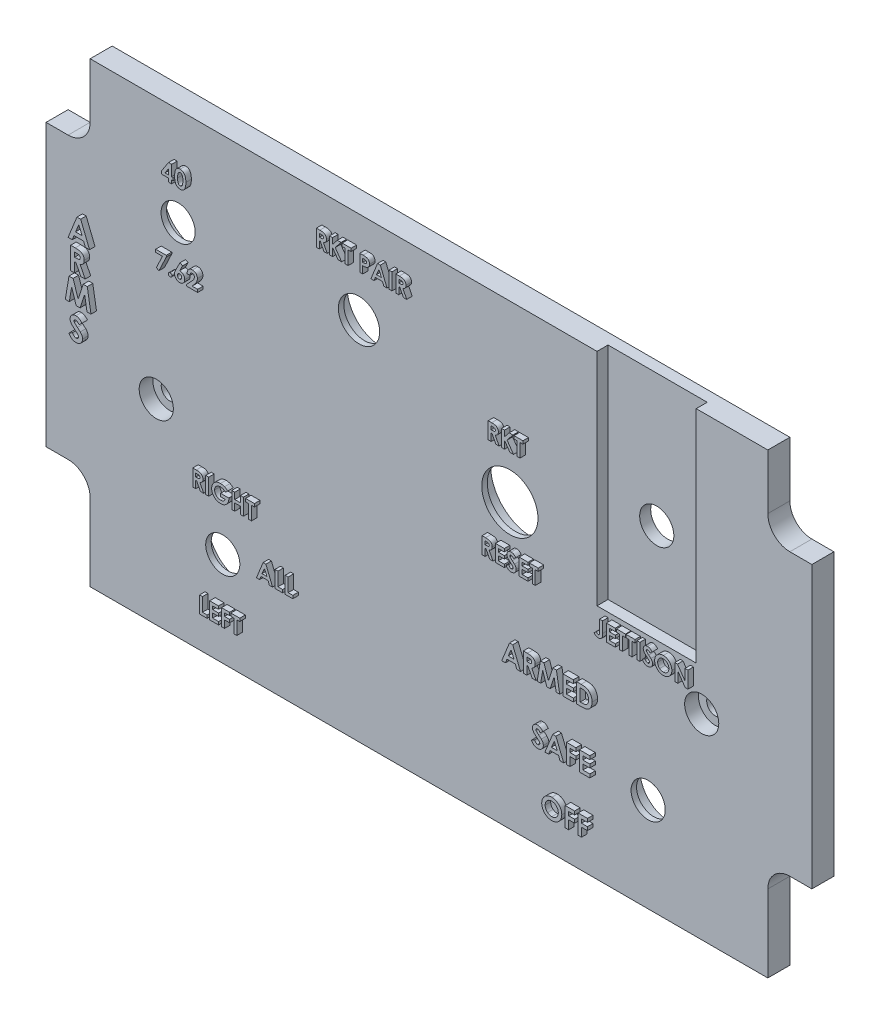
from build123d import *

# Parameters (mm, degrees)
SKETCH1_R            = 1.6
SKETCH1_R_2          = 3.1
SKETCH1_R_3          = 5.1
SKETCH1_R_4          = 3.75
BOSS_EXTRUDE1_DEPTH  = 4
SKETCH5_R            = 5.5
SKETCH5_R_2          = 3.1
SKETCH5_R_3          = 6.15
SKETCH5_R_4          = 3.75
SKETCH5_R_5          = 7.5
SKETCH5_R_6          = 6.75
BACK_HOLES_DEPTH     = 3
SKETCH6_R            = 3.1
CAMA_TORNILLOS_DEPTH = 2.5
SKETCH4_W            = 0.538461539
SKETCH4_H            = 3
SKETCH4_W_2          = 0.538461538
TEXTOS_DEPTH         = 1
SKETCH8_W            = 18.000372339
SKETCH8_H            = 40
CUT_EXTRUDE3_DEPTH   = 2


with BuildPart() as part:
    # Sketch1 → Boss-Extrude1 (new body)
    with BuildSketch(Plane.XY):
        with BuildLine():
            Line((8, 6.645362503), (131, 6.645362503))
            Line((131, 6.645362503), (131, 20.645362503))
            ThreePointArc((131, 20.645362503), (132.171572875, 23.473789627), (135, 24.645362503))
            Line((135, 24.645362503), (139, 24.645362503))
            Line((139, 24.645362503), (139, 75.645362503))
            Line((139, 75.645362503), (135, 75.645362503))
            ThreePointArc((135, 75.645362503), (132.171572875, 76.816935378), (131, 79.645362503))
            Line((131, 79.645362503), (131, 89.645362503))
            Line((131, 89.645362503), (8, 89.645362503))
            Line((8, 89.645362503), (8, 79.645362503))
            ThreePointArc((8, 79.645362503), (6.828427125, 76.816935378), (4, 75.645362503))
            Line((4, 75.645362503), (0, 75.645362503))
            Line((0, 75.645362503), (0, 24.645362503))
            Line((0, 24.645362503), (4, 24.645362503))
            ThreePointArc((4, 24.645362503), (6.828427125, 23.473789627), (8, 20.645362503))
            Line((8, 20.645362503), (8, 6.645362503))
        make_face()
        with Locations((119, 42.17362973)):
            Circle(SKETCH1_R, mode=Mode.SUBTRACT)
        with Locations((109.281287349, 23.745748032)):
            Circle(SKETCH1_R_2, mode=Mode.SUBTRACT)
        with Locations((108.842722678, 65.645362503)):
            Circle(SKETCH1_R_2, mode=Mode.SUBTRACT)
        with Locations((84.178955025, 58.025965012)):
            Circle(SKETCH1_R_3, mode=Mode.SUBTRACT)
        with Locations((56.797589152, 72.972828616)):
            Circle(SKETCH1_R_4, mode=Mode.SUBTRACT)
        with Locations((32.070123038, 23.745748032)):
            Circle(SKETCH1_R_2, mode=Mode.SUBTRACT)
        with Locations((20, 42.17362973)):
            Circle(SKETCH1_R, mode=Mode.SUBTRACT)
        with Locations((23.966882531, 71.893095658)):
            Circle(SKETCH1_R_2, mode=Mode.SUBTRACT)
    extrude(amount=BOSS_EXTRUDE1_DEPTH)

    # Sketch5 → Back Holes (cut)
    # profile 1 of 5: a face of its own
    with BuildSketch(Plane(origin=(0, 0, 0), x_dir=(-1, 0, 0), z_dir=(0, 0, -1))):
        with Locations((-109.281287349, 23.745748032)):
            Circle(SKETCH5_R)
        with Locations((-109.281287349, 23.745748032)):
            Circle(SKETCH5_R_2, mode=Mode.SUBTRACT)
    # profile 2 of 5: a face of its own
    with BuildSketch(Plane(origin=(0, 0, 0), x_dir=(-1, 0, 0), z_dir=(0, 0, -1))):
        with Locations((-56.797589152, 72.972828616)):
            Circle(SKETCH5_R_3)
        with Locations((-56.797589152, 72.972828616)):
            Circle(SKETCH5_R_4, mode=Mode.SUBTRACT)
    # profile 3 of 5: a face of its own
    with BuildSketch(Plane(origin=(0, 0, 0), x_dir=(-1, 0, 0), z_dir=(0, 0, -1))):
        with Locations((-84.178955025, 58.025965012)):
            Circle(SKETCH5_R_5)
    # profile 4 of 5: a face of its own
    with BuildSketch(Plane(origin=(0, 0, 0), x_dir=(-1, 0, 0), z_dir=(0, 0, -1))):
        with Locations((-23.966882531, 71.893095658)):
            Circle(SKETCH5_R_6)
        with Locations((-23.966882531, 71.893095658)):
            Circle(SKETCH5_R_2, mode=Mode.SUBTRACT)
    # profile 5 of 5: a face of its own
    with BuildSketch(Plane(origin=(0, 0, 0), x_dir=(-1, 0, 0), z_dir=(0, 0, -1))):
        with Locations((-32.070123038, 23.745748032)):
            Circle(SKETCH5_R_6)
        with Locations((-32.070123038, 23.745748032)):
            Circle(SKETCH5_R_2, mode=Mode.SUBTRACT)
    extrude(amount=-BACK_HOLES_DEPTH, mode=Mode.SUBTRACT)

    # Sketch6 → Cama tornillos (cut)
    with BuildSketch(Plane.XY.offset(4)):
        with Locations((20, 42.17362973)):
            Circle(SKETCH6_R)
        with Locations((119, 42.17362973)):
            Circle(SKETCH6_R)
    extrude(amount=-CAMA_TORNILLOS_DEPTH, mode=Mode.SUBTRACT)

    # Sketch4 → Textos (add)
    # profile 1 of 57: a face of its own
    with BuildSketch(Plane.XY.offset(4)):
        Polygon((6.607732474, 64.566037828), (7.275200422, 64.566037828), (8.890585038, 60.566037828), (8.123758115, 60.566037828), (7.812860679, 61.386550649), (6.071674781, 61.386550649), (5.759976063, 60.566037828), (4.99314914, 60.566037828), align=None)
        Polygon((6.941867089, 63.493121162), (6.344110679, 62.104499367), (7.540424781, 62.104499367), align=None, mode=Mode.SUBTRACT)
    # profile 2 of 57: a face of its own
    with BuildSketch(Plane.XY.offset(4)):
        Polygon((20.891445691, 66.65098981), (22.814522614, 66.65098981), (22.814522614, 66.371542695), (21.491205306, 63.574066733), (21.014642806, 63.814451349), (22.119811075, 66.15098981), (20.891445691, 66.15098981), align=None)
    # profile 3 of 57: a face of its own
    with BuildSketch(Plane.XY.offset(4)):
        with BuildLine():
            add(Edge.make_bspline(
                [(23.526061075, 64.266374425), (23.547798129, 64.265182635), (23.590594634, 64.262836205), (23.652429748, 64.245325047), (23.708236295, 64.213863757), (23.758134805, 64.172827956), (23.800327728, 64.123456409), (23.830823818, 64.067154196), (23.849814499, 64.005557341), (23.851911083, 63.962626193), (23.852984152, 63.940653272)],
                knots=[0, 0, 0, 0, 1.016957001, 2.002212695, 2.9757545, 3.99499976, 5.013036768, 5.994806404, 6.97370641, 8, 8, 8, 8], degree=3))
            add(Edge.make_bspline(
                [(23.852984152, 63.940653272), (23.851918113, 63.918676821), (23.849835263, 63.875738778), (23.830692404, 63.814021897), (23.800373298, 63.757256931), (23.758131419, 63.707356336), (23.708442942, 63.665547177), (23.652301439, 63.634376006), (23.590712429, 63.615871484), (23.547818862, 63.613653397), (23.526061075, 63.612528272)],
                knots=[0, 0, 0, 0, 1.023218912, 1.999186227, 2.986238111, 4.008388923, 5.030539734, 6.0011649, 6.986089706, 8, 8, 8, 8], degree=3))
            add(Edge.make_bspline(
                [(23.526061075, 63.612528272), (23.504298133, 63.613644248), (23.461394403, 63.615844298), (23.399709656, 63.634531981), (23.343153673, 63.665339066), (23.293452712, 63.70740705), (23.251022115, 63.757080229), (23.221565009, 63.814201001), (23.20224384, 63.87571551), (23.200189464, 63.918668944), (23.199137998, 63.940653272)],
                knots=[0, 0, 0, 0, 1.013427518, 1.99788335, 2.976245624, 3.997909735, 5.019573847, 6.001765691, 6.977268297, 8, 8, 8, 8], degree=3))
            add(Edge.make_bspline(
                [(23.199137998, 63.940653272), (23.200196401, 63.962634208), (23.20226433, 64.005581014), (23.221433969, 64.06697303), (23.251069325, 64.123634072), (23.293449173, 64.172777136), (23.343361385, 64.214070243), (23.399580627, 64.24517121), (23.461512138, 64.262863592), (23.504318841, 64.26519186), (23.526061075, 64.266374425)],
                knots=[0, 0, 0, 0, 1.025808215, 2.00424526, 2.981110158, 3.998665696, 5.017428914, 5.998734231, 6.983523959, 8, 8, 8, 8], degree=3))
        make_face()
    # profile 4 of 57: a face of its own
    with BuildSketch(Plane.XY.offset(4)):
        with BuildLine():
            Line((25.302503383, 66.727912887), (25.779666844, 66.485725387))
            Line((25.779666844, 66.485725387), (25.256830306, 65.458682118))
            add(Edge.make_bspline(
                [(25.256830306, 65.458682118), (25.287720643, 65.457894704), (25.348365848, 65.456348821), (25.437661971, 65.44350434), (25.52305064, 65.421573461), (25.605552834, 65.392393489), (25.683973661, 65.35321654), (25.759574549, 65.306610582), (25.83040009, 65.249770423), (25.898074135, 65.186794333), (25.959609803, 65.117025934), (26.013064408, 65.042057558), (26.059649153, 64.963713212), (26.095862259, 64.880240139), (26.125072956, 64.793022001), (26.146149759, 64.70171015), (26.158174665, 64.606040166), (26.159832499, 64.541047212), (26.16067646, 64.507960964)],
                knots=[0, 0, 0, 0, 1.013672955, 1.990085268, 2.953345895, 3.903887042, 4.856677135, 5.825509993, 6.813434118, 7.832212698, 8.85718992, 9.860832204, 10.8510077, 11.84312444, 12.841215551, 13.86684641, 14.914066156, 16, 16, 16, 16], degree=3))
            add(Edge.make_bspline(
                [(26.16067646, 64.507960964), (26.159885599, 64.476067828), (26.158322405, 64.413028775), (26.145400544, 64.320440438), (26.124518138, 64.231607343), (26.094672985, 64.146706902), (26.056737383, 64.065324117), (26.010344711, 63.987506746), (25.955110231, 63.913836292), (25.892461052, 63.844704205), (25.82397469, 63.781689796), (25.751786336, 63.725678922), (25.675284272, 63.679411815), (25.595914478, 63.640338159), (25.512215707, 63.611180747), (25.425440516, 63.589171951), (25.334930863, 63.576471921), (25.273495229, 63.574874878), (25.242407229, 63.574066733)],
                knots=[0, 0, 0, 0, 1.049934834, 2.075270938, 3.072134561, 4.05064612, 5.033440221, 6.024524368, 7.028587226, 8.060776465, 9.092543989, 10.090062252, 11.064205434, 12.031961459, 12.998029633, 13.977230324, 14.976426867, 16, 16, 16, 16], degree=3))
            add(Edge.make_bspline(
                [(25.242407229, 63.574066733), (25.209898628, 63.574729935), (25.145974863, 63.576034031), (25.052438396, 63.590636468), (24.962728875, 63.612618401), (24.87735048, 63.644004867), (24.79577227, 63.683969578), (24.718954679, 63.733421888), (24.646250628, 63.791816471), (24.578435247, 63.85783954), (24.517338642, 63.93015878), (24.462845577, 64.005244979), (24.416744373, 64.083215965), (24.379426524, 64.163988372), (24.350310272, 64.247304815), (24.3300513, 64.333323422), (24.316850709, 64.421816028), (24.315303241, 64.481872118), (24.314522614, 64.512167695)],
                knots=[0, 0, 0, 0, 1.063775006, 2.091769615, 3.092589432, 4.084662827, 5.064601646, 6.061867366, 7.070035304, 8.113879863, 9.156342271, 10.166834137, 11.149076039, 12.117706134, 13.076241869, 14.034148791, 15.008317125, 16, 16, 16, 16], degree=3))
            add(Edge.make_bspline(
                [(24.314522614, 64.512167695), (24.314935082, 64.535628075), (24.315762314, 64.582679425), (24.324075506, 64.653136266), (24.336714478, 64.723778049), (24.351364701, 64.783387822), (24.366450021, 64.833794124), (24.381633511, 64.876451615), (24.400450102, 64.923792102), (24.421960252, 64.975936475), (24.446840378, 65.032822003), (24.474960511, 65.094293631), (24.506390656, 65.160816869), (24.528804678, 65.206508033), (24.540484152, 65.230316733)],
                knots=[0, 0, 0, 0, 1.110454016, 2.227089276, 3.35462975, 4.507227546, 5.131400587, 5.845402449, 6.650387134, 7.543487832, 8.516250726, 9.590168902, 10.744287919, 12, 12, 12, 12], degree=3))
            Line((24.540484152, 65.230316733), (25.302503383, 66.727912887))
        make_face()
        with BuildLine():
            add(Edge.make_bspline(
                [(25.230387998, 64.958682118), (25.204550975, 64.957497028), (25.153991311, 64.955177963), (25.082103031, 64.930891586), (25.01655723, 64.892792305), (24.959741319, 64.839731689), (24.912220038, 64.776322168), (24.877299732, 64.70399514), (24.856293228, 64.623715789), (24.854110787, 64.567585805), (24.852984152, 64.538610002)],
                knots=[0, 0, 0, 0, 0.981744412, 1.921144944, 2.858899012, 3.85339082, 4.86292663, 5.863643845, 6.897155691, 8, 8, 8, 8], degree=3))
            add(Edge.make_bspline(
                [(24.852984152, 64.538610002), (24.854318123, 64.509624551), (24.856912785, 64.453245911), (24.878709161, 64.372202157), (24.914396593, 64.298232666), (24.964445939, 64.233982831), (25.023203153, 64.180650494), (25.088357933, 64.141208681), (25.158823476, 64.116978281), (25.207566213, 64.114021851), (25.232190883, 64.112528272)],
                knots=[0, 0, 0, 0, 1.098279937, 2.136227893, 3.159405121, 4.194678092, 5.206500211, 6.154139736, 7.067477469, 8, 8, 8, 8], degree=3))
            add(Edge.make_bspline(
                [(25.232190883, 64.112528272), (25.258197318, 64.114048452), (25.309200454, 64.11702979), (25.382775822, 64.14024062), (25.449987363, 64.179021653), (25.509415365, 64.232183242), (25.56046289, 64.2956999), (25.595782621, 64.370103877), (25.618586654, 64.451732576), (25.620978383, 64.509001573), (25.622214921, 64.538610002)],
                knots=[0, 0, 0, 0, 0.96921794, 1.900804717, 2.848419905, 3.844199796, 4.861108892, 5.867439427, 6.897452859, 8, 8, 8, 8], degree=3))
            add(Edge.make_bspline(
                [(25.622214921, 64.538610002), (25.620806278, 64.567568886), (25.618078275, 64.623651146), (25.597587743, 64.704306587), (25.561003282, 64.77635484), (25.512406793, 64.839993433), (25.45363558, 64.89303039), (25.385466502, 64.931192049), (25.310294246, 64.955134936), (25.25741176, 64.957482484), (25.230387998, 64.958682118)],
                knots=[0, 0, 0, 0, 1.083229974, 2.097801324, 3.086792542, 4.086858909, 5.079819718, 6.026392613, 6.991456328, 8, 8, 8, 8], degree=3))
        make_face(mode=Mode.SUBTRACT)
    # profile 5 of 57: a face of its own
    with BuildSketch(Plane.XY.offset(4)):
        with BuildLine():
            Line((27.122214921, 65.65098981), (26.583753383, 65.65098981))
            add(Edge.make_bspline(
                [(26.583753383, 65.65098981), (26.586078916, 65.691721577), (26.590622867, 65.771309003), (26.608697558, 65.886912289), (26.632917023, 65.996144681), (26.665241114, 66.098624074), (26.705858449, 66.19431323), (26.75372384, 66.283538357), (26.810060139, 66.365829684), (26.873668324, 66.440790356), (26.943468503, 66.508038266), (27.018011556, 66.567664488), (27.098437719, 66.616866546), (27.18327754, 66.657355285), (27.272516573, 66.689703905), (27.366999159, 66.711331576), (27.465907218, 66.725978046), (27.533617793, 66.727259671), (27.568128383, 66.727912887)],
                knots=[0, 0, 0, 0, 1.199038563, 2.342849363, 3.436047546, 4.486744587, 5.497670872, 6.488682221, 7.459191391, 8.424610317, 9.374430501, 10.305433194, 11.225809216, 12.140057399, 13.06607119, 14.010487599, 14.985989317, 16, 16, 16, 16], degree=3))
            add(Edge.make_bspline(
                [(27.568128383, 66.727912887), (27.610489642, 66.726591104), (27.693188748, 66.724010674), (27.813357109, 66.701998749), (27.925581219, 66.665180402), (28.029779502, 66.613735462), (28.1250649, 66.548380058), (28.211421611, 66.470454435), (28.286238072, 66.378323673), (28.34998864, 66.275821182), (28.402957743, 66.16728547), (28.440076284, 66.055055043), (28.464473902, 65.942108042), (28.467076059, 65.866055248), (28.468368767, 65.828273464)],
                knots=[0, 0, 0, 0, 1.075374347, 2.099382735, 3.09057751, 4.06680945, 5.040638231, 6.016817125, 7.011024321, 8.044445721, 9.0776792, 10.070479129, 11.0414456, 12, 12, 12, 12], degree=3))
            add(Edge.make_bspline(
                [(28.468368767, 65.828273464), (28.467865455, 65.805420371), (28.466852411, 65.759422739), (28.459808582, 65.689817034), (28.449241446, 65.618915484), (28.433308781, 65.546778883), (28.413439441, 65.473387009), (28.389335059, 65.398520225), (28.360436512, 65.322602998), (28.327226056, 65.244780894), (28.287605899, 65.164801254), (28.241473733, 65.081465152), (28.187605105, 64.994846514), (28.126650682, 64.904456263), (28.058314423, 64.810436959), (27.982262731, 64.713071816), (27.899371544, 64.612017751), (27.840541337, 64.54446878), (27.810315883, 64.509763849)],
                knots=[0, 0, 0, 0, 0.728284026, 1.46585585, 2.227944881, 3.01186502, 3.81876927, 4.650621989, 5.517437689, 6.406905708, 7.346299482, 8.360816762, 9.441613733, 10.596154504, 11.834900912, 13.145207542, 14.533280747, 16, 16, 16, 16], degree=3))
            Line((27.810315883, 64.509763849), (27.497214921, 64.15098981))
            Line((27.497214921, 64.15098981), (28.506830306, 64.15098981))
            Line((28.506830306, 64.15098981), (28.506830306, 63.65098981))
            Line((28.506830306, 63.65098981), (26.506830306, 63.65098981))
            Line((26.506830306, 63.65098981), (26.506830306, 63.923826349))
            Line((26.506830306, 63.923826349), (27.39505146, 64.869138849))
            add(Edge.make_bspline(
                [(27.39505146, 64.869138849), (27.420767745, 64.896713908), (27.470572562, 64.95011862), (27.541439685, 65.028549121), (27.605568171, 65.102977795), (27.661628264, 65.174197156), (27.712561926, 65.239897138), (27.756098028, 65.302058022), (27.792634892, 65.360117849), (27.83230084, 65.43012786), (27.869970451, 65.513627257), (27.904534599, 65.609821986), (27.925603839, 65.701761993), (27.928512061, 65.761672078), (27.929907229, 65.790412887)],
                knots=[0, 0, 0, 0, 1.246127091, 2.413378631, 3.493388633, 4.492180848, 5.408488754, 6.240484944, 6.999099869, 7.674939598, 8.898438119, 10.020720584, 11.050475521, 12, 12, 12, 12], degree=3))
            add(Edge.make_bspline(
                [(27.929907229, 65.790412887), (27.928864096, 65.818217403), (27.926842857, 65.872093109), (27.904631086, 65.948731015), (27.870219839, 66.018118816), (27.821729533, 66.078183125), (27.762992585, 66.127541951), (27.695116524, 66.164253658), (27.61865474, 66.185436146), (27.565053572, 66.188087436), (27.537479344, 66.189451349)],
                knots=[0, 0, 0, 0, 1.062038974, 2.057870785, 3.028805853, 4.01125022, 4.991535629, 5.949134679, 6.94496649, 8, 8, 8, 8], degree=3))
            add(Edge.make_bspline(
                [(27.537479344, 66.189451349), (27.523234147, 66.188947503), (27.495190188, 66.187955602), (27.453967761, 66.181352786), (27.41474166, 66.169716013), (27.377075276, 66.154124374), (27.341370596, 66.133457545), (27.307717678, 66.107982386), (27.275761945, 66.078346278), (27.245649961, 66.044641889), (27.218244123, 66.007027782), (27.193902359, 65.965847483), (27.173775772, 65.921126556), (27.156055594, 65.873455383), (27.142388944, 65.822321939), (27.132437928, 65.768032251), (27.124872835, 65.710674641), (27.12311701, 65.671246678), (27.122214921, 65.65098981)],
                knots=[0, 0, 0, 0, 0.903469896, 1.778625579, 2.63899355, 3.493148037, 4.358286772, 5.247621495, 6.164656832, 7.118446693, 8.109501108, 9.111810964, 10.146451449, 11.215617525, 12.33435995, 13.498009769, 14.714554818, 16, 16, 16, 16], degree=3))
        make_face()
    # profile 6 of 57: a face of its own
    with BuildSketch(Plane.XY.offset(4)):
        with BuildLine():
            Line((27.628159589, 35.635642408), (28.255563435, 35.635642408))
            add(Edge.make_bspline(
                [(28.255563435, 35.635642408), (28.297034638, 35.635495209), (28.376795444, 35.635212104), (28.491806169, 35.630745456), (28.597459337, 35.624529748), (28.693911376, 35.615044413), (28.781121023, 35.602468006), (28.859175683, 35.587642502), (28.928073073, 35.570745662), (28.988394248, 35.549690867), (29.042831125, 35.525941377), (29.093573863, 35.498652777), (29.141741922, 35.468128935), (29.18701335, 35.433566686), (29.229781567, 35.395587796), (29.270127258, 35.354154036), (29.307480299, 35.308914064), (29.341609401, 35.26015374), (29.37271533, 35.208858997), (29.400206447, 35.154959407), (29.422562269, 35.098417487), (29.442316035, 35.04005039), (29.456544032, 34.979023746), (29.466439396, 34.915931661), (29.473684394, 34.850552043), (29.474100947, 34.806136033), (29.474313435, 34.783478947)],
                knots=[0, 0, 0, 0, 1.749336639, 3.364467119, 4.854658419, 6.213483162, 7.451590619, 8.570285859, 9.5643256, 10.440900261, 11.26203566, 12.067320669, 12.869050712, 13.665104639, 14.467235401, 15.27997916, 16.102287765, 16.939272006, 17.78853747, 18.631303466, 19.488103222, 20.351255419, 21.228522269, 22.127379805, 23.044756219, 24, 24, 24, 24], degree=3))
            add(Edge.make_bspline(
                [(29.474313435, 34.783478947), (29.473761468, 34.759830154), (29.47267916, 34.713459181), (29.466849261, 34.645344003), (29.456194037, 34.580176166), (29.440055151, 34.518146472), (29.421505598, 34.45848289), (29.39683945, 34.40228625), (29.369001264, 34.348739254), (29.335938664, 34.298599343), (29.299654076, 34.250752811), (29.257455863, 34.207032835), (29.212077822, 34.165089632), (29.160969087, 34.127550383), (29.106382579, 34.091876818), (29.047233722, 34.059547068), (28.98390854, 34.029748438), (28.939387802, 34.013130663), (28.916621127, 34.004632793)],
                knots=[0, 0, 0, 0, 1.099860209, 2.156625411, 3.176576793, 4.16617041, 5.135385252, 6.078461593, 7.016046972, 7.938469504, 8.868247731, 9.803980173, 10.76021508, 11.73834243, 12.748633912, 13.790971185, 14.870363756, 16, 16, 16, 16], degree=3))
            Line((28.916621127, 34.004632793), (29.60892882, 32.635642408))
            Line((29.60892882, 32.635642408), (29.010371127, 32.635642408))
            Line((29.010371127, 32.635642408), (28.349313435, 33.943334716))
            Line((28.349313435, 33.943334716), (28.166621127, 33.943334716))
            Line((28.166621127, 33.943334716), (28.166621127, 32.635642408))
            Line((28.166621127, 32.635642408), (27.628159589, 32.635642408))
            Line((27.628159589, 32.635642408), (27.628159589, 35.635642408))
        make_face()
        with BuildLine():
            Line((28.166621127, 34.481796255), (28.376356704, 34.481796255))
            add(Edge.make_bspline(
                [(28.376356704, 34.481796255), (28.401998622, 34.482085051), (28.451097385, 34.482638034), (28.521707854, 34.485203), (28.585839, 34.4913833), (28.643766223, 34.499191877), (28.695781008, 34.508208008), (28.741419402, 34.52112867), (28.781384621, 34.534973487), (28.815203078, 34.552179003), (28.84409679, 34.571745407), (28.869044661, 34.593973327), (28.889680128, 34.619699315), (28.906664169, 34.648224249), (28.919875907, 34.679800424), (28.929519463, 34.714081207), (28.934908785, 34.751457098), (28.935528845, 34.777251553), (28.935851897, 34.790690485)],
                knots=[0, 0, 0, 0, 1.688639943, 3.233382647, 4.650958383, 5.928841754, 7.082724185, 8.122798841, 9.049171256, 9.863274652, 10.613301712, 11.341792392, 12.054588806, 12.776240173, 13.521029143, 14.301969904, 15.115324896, 16, 16, 16, 16], degree=3))
            add(Edge.make_bspline(
                [(28.935851897, 34.790690485), (28.935241138, 34.806589723), (28.934041415, 34.83782083), (28.92213644, 34.882782673), (28.903186292, 34.924397935), (28.877210828, 34.962478588), (28.844498109, 34.995862717), (28.806957683, 35.025291093), (28.763779337, 35.048560851), (28.723799438, 35.063909335), (28.687427074, 35.073092491), (28.654602164, 35.079935698), (28.61659072, 35.084785675), (28.573364046, 35.08992994), (28.525032328, 35.093265735), (28.47133213, 35.0957002), (28.412417678, 35.096696259), (28.371348709, 35.097014682), (28.349914397, 35.09718087)],
                knots=[0, 0, 0, 0, 1.020303359, 2.004196876, 2.966617323, 3.9489082, 4.950758222, 5.960522915, 7.003732012, 8.091992268, 8.70421221, 9.413913587, 10.24622431, 11.166358409, 12.212345909, 13.359657661, 14.621978493, 16, 16, 16, 16], degree=3))
            Line((28.349914397, 35.09718087), (28.166621127, 35.09718087))
            Line((28.166621127, 35.09718087), (28.166621127, 34.481796255))
        make_face(mode=Mode.SUBTRACT)
    # profile 7 of 57: a face of its own
    with BuildSketch(Plane.XY.offset(4)):
        with Locations((30.243544205, 34.135642408)):
            Rectangle(SKETCH4_W, SKETCH4_H)
    # profile 8 of 57: a face of its own
    with BuildSketch(Plane.XY.offset(4)):
        with BuildLine():
            Line((33.954481704, 35.158478947), (33.547029781, 34.768454908))
            add(Edge.make_bspline(
                [(33.547029781, 34.768454908), (33.514771102, 34.80075224), (33.451474246, 34.864124936), (33.347960157, 34.946608855), (33.240750977, 35.016736493), (33.129493837, 35.074400342), (33.014033754, 35.119129437), (32.894598583, 35.151125589), (32.770994015, 35.170103049), (32.687319241, 35.172759829), (32.644986512, 35.174103947)],
                knots=[0, 0, 0, 0, 1.075575784, 2.110457258, 3.113929901, 4.09197124, 5.059417775, 6.02750972, 7.002078037, 8, 8, 8, 8], degree=3))
            add(Edge.make_bspline(
                [(32.644986512, 35.174103947), (32.608285331, 35.17316213), (32.536219344, 35.171312789), (32.430325317, 35.157269024), (32.329137088, 35.133809546), (32.232176602, 35.101310356), (32.140035835, 35.059018639), (32.052180907, 35.007587117), (31.969152479, 34.946622334), (31.891604339, 34.877279972), (31.820996508, 34.801572113), (31.759352143, 34.720537933), (31.706844388, 34.635687841), (31.663619796, 34.54658773), (31.630730583, 34.453374352), (31.607251988, 34.356115376), (31.592348918, 34.255093448), (31.590589311, 34.186175243), (31.589698051, 34.151267408)],
                knots=[0, 0, 0, 0, 1.075001177, 2.110859044, 3.123021556, 4.114053297, 5.101481495, 6.087880186, 7.091499647, 8.114004866, 9.131394192, 10.11971144, 11.092043119, 12.050101265, 13.015322563, 13.981809771, 14.977764287, 16, 16, 16, 16], degree=3))
            add(Edge.make_bspline(
                [(31.589698051, 34.151267408), (31.590529376, 34.115151367), (31.5921672, 34.043997821), (31.607900357, 33.939576933), (31.632139993, 33.839116514), (31.667620357, 33.743361958), (31.71128594, 33.65100156), (31.766661093, 33.563824429), (31.831234064, 33.480499276), (31.904889468, 33.402476838), (31.985007527, 33.330558927), (32.071777992, 33.268520685), (32.162560772, 33.214995075), (32.258821107, 33.172604521), (32.358888202, 33.138569551), (32.463777024, 33.114571976), (32.57325139, 33.099849547), (32.647944763, 33.098079284), (32.685851897, 33.09718087)],
                knots=[0, 0, 0, 0, 1.022067601, 2.013613092, 2.983553406, 3.943623673, 4.90013463, 5.87121881, 6.861774014, 7.881098904, 8.905697761, 9.905387765, 10.89678721, 11.884561068, 12.87834324, 13.885584958, 14.926927371, 16, 16, 16, 16], degree=3))
            add(Edge.make_bspline(
                [(32.685851897, 33.09718087), (32.710509083, 33.097403347), (32.758916627, 33.09784012), (32.829922245, 33.104930173), (32.897928572, 33.115066227), (32.963198978, 33.128485159), (33.025074407, 33.147475356), (33.084411566, 33.169682052), (33.140862793, 33.195890382), (33.194122014, 33.227004582), (33.244981882, 33.261879796), (33.292966337, 33.301784457), (33.338917085, 33.345818862), (33.382297195, 33.394520954), (33.422372448, 33.448326186), (33.460426752, 33.506245816), (33.496024393, 33.568854661), (33.517058099, 33.613065856), (33.527799012, 33.635642408)],
                knots=[0, 0, 0, 0, 1.109579412, 2.178351274, 3.208885622, 4.204702371, 5.174744997, 6.119429583, 7.05542196, 7.97267548, 8.893247984, 9.828544973, 10.778894627, 11.756245826, 12.760884819, 13.796418446, 14.874735809, 16, 16, 16, 16], degree=3))
            Line((33.527799012, 33.635642408), (32.666621127, 33.635642408))
            Line((32.666621127, 33.635642408), (32.666621127, 34.174103947))
            Line((32.666621127, 34.174103947), (34.162414397, 34.174103947))
            Line((34.162414397, 34.174103947), (34.166621127, 34.046099139))
            add(Edge.make_bspline(
                [(34.166621127, 34.046099139), (34.166080594, 34.013224257), (34.165000491, 33.94753316), (34.155129487, 33.849730308), (34.138778318, 33.753224607), (34.116424705, 33.658112987), (34.088409973, 33.56392889), (34.052682421, 33.471574208), (34.010845675, 33.380422621), (33.96397057, 33.290861453), (33.911296439, 33.204925078), (33.854585002, 33.123554675), (33.794644721, 33.046891079), (33.730171917, 32.976002405), (33.66217054, 32.910293158), (33.590506727, 32.850016129), (33.514927008, 32.795120316), (33.435831758, 32.745141975), (33.352770454, 32.701338908), (33.266199767, 32.663236051), (33.176250406, 32.630876099), (33.082690143, 32.604347978), (32.985703082, 32.583879422), (32.885287144, 32.569844106), (32.781387182, 32.560306951), (32.710914035, 32.559254936), (32.675034589, 32.558719331)],
                knots=[0, 0, 0, 0, 1.006889344, 2.011981806, 3.007738725, 4.003571281, 5.003404394, 6.015442001, 7.03424805, 8.074616296, 9.110249922, 10.119753985, 11.111721717, 12.089233633, 13.052717867, 14.006597561, 14.955430184, 15.912305663, 16.870361111, 17.829300583, 18.807640451, 19.796414044, 20.806216501, 21.841577364, 22.90109906, 24, 24, 24, 24], degree=3))
            add(Edge.make_bspline(
                [(32.675034589, 32.558719331), (32.636753653, 32.559248251), (32.560869421, 32.560296726), (32.448664412, 32.570116415), (32.339714541, 32.586323178), (32.233992633, 32.608752784), (32.131253221, 32.63666822), (32.03167283, 32.671708696), (31.935455127, 32.71339045), (31.842311985, 32.760609734), (31.753433876, 32.814160514), (31.66901999, 32.873103772), (31.589531072, 32.937818663), (31.514152912, 33.007221846), (31.444646633, 33.083019257), (31.378422009, 33.162753935), (31.318687395, 33.249350229), (31.262874381, 33.340000662), (31.213289653, 33.434667247), (31.169927096, 33.531599077), (31.132947532, 33.630234916), (31.103788252, 33.731034045), (31.080113648, 33.833293608), (31.063174024, 33.937458309), (31.053607427, 34.043515109), (31.052030325, 34.114790772), (31.051236512, 34.150666447)],
                knots=[0, 0, 0, 0, 1.084149091, 2.14910686, 3.187506334, 4.202448172, 5.208724393, 6.201130722, 7.189831603, 8.176984443, 9.156919086, 10.126598231, 11.090766514, 12.05840148, 13.026036446, 14.001772938, 14.991905635, 16.003017641, 17.015720547, 18.016462227, 19.009322657, 19.99686681, 20.986544154, 21.980959929, 22.983742515, 24, 24, 24, 24], degree=3))
            add(Edge.make_bspline(
                [(31.051236512, 34.150666447), (31.052299598, 34.199608534), (31.054398876, 34.296254647), (31.073841384, 34.438614984), (31.104149356, 34.576334406), (31.147644347, 34.708911347), (31.203458693, 34.836528434), (31.270801731, 34.959485254), (31.351136299, 35.077651115), (31.413320772, 35.150812194), (31.44486632, 35.187926062)],
                knots=[0, 0, 0, 0, 1.034044851, 2.041932006, 3.031217818, 4.011390712, 4.986069675, 5.97149666, 6.970960976, 8, 8, 8, 8], degree=3))
            add(Edge.make_bspline(
                [(31.44486632, 35.187926062), (31.464452642, 35.20939756), (31.503331198, 35.25201816), (31.565478499, 35.311240351), (31.629201872, 35.366911401), (31.695383897, 35.417850842), (31.763676668, 35.46517376), (31.834276742, 35.507993052), (31.906813769, 35.547672106), (31.981853448, 35.582184758), (32.059002938, 35.61312823), (32.13860392, 35.639310757), (32.220060201, 35.662502254), (32.304093077, 35.680145035), (32.389853617, 35.694836596), (32.477950577, 35.70468365), (32.568143889, 35.711900839), (32.629146108, 35.712342184), (32.660010551, 35.712565485)],
                knots=[0, 0, 0, 0, 1.020590567, 2.025856924, 3.013483481, 3.991664875, 4.957826714, 5.930500614, 6.890802512, 7.860442893, 8.829981142, 9.809047939, 10.802672283, 11.803273349, 12.823572789, 13.857849586, 14.916166035, 16, 16, 16, 16], degree=3))
            add(Edge.make_bspline(
                [(32.660010551, 35.712565485), (32.692273913, 35.712067929), (32.756466158, 35.711077974), (32.851909396, 35.704228133), (32.946026386, 35.693660442), (33.03842051, 35.677808302), (33.129401843, 35.658259315), (33.218499444, 35.633212224), (33.306294565, 35.604754216), (33.363448856, 35.58206539), (33.391981704, 35.570738562)],
                knots=[0, 0, 0, 0, 1.03180557, 2.052914215, 3.058998889, 4.059601663, 5.049854447, 6.033765722, 7.018406786, 8, 8, 8, 8], degree=3))
            add(Edge.make_bspline(
                [(33.391981704, 35.570738562), (33.415988567, 35.560270534), (33.46481786, 35.538978855), (33.535858465, 35.500024729), (33.60707264, 35.45683961), (33.677691951, 35.407844549), (33.747608792, 35.35313119), (33.817553169, 35.293563721), (33.886811066, 35.228447551), (33.931632697, 35.182103862), (33.954481704, 35.158478947)],
                knots=[0, 0, 0, 0, 0.894392155, 1.819168899, 2.76525314, 3.739198753, 4.75366411, 5.797420238, 6.877176959, 8, 8, 8, 8], degree=3))
        make_face()
    # profile 9 of 57: a face of its own
    with BuildSketch(Plane.XY.offset(4)):
        Polygon((34.705082666, 35.635642408), (35.243544204, 35.635642408), (35.243544204, 34.481796255), (36.282005743, 34.481796255), (36.282005743, 35.635642408), (36.820467281, 35.635642408), (36.820467281, 32.635642408), (36.282005743, 32.635642408), (36.282005743, 33.943334716), (35.243544204, 33.943334716), (35.243544204, 32.635642408), (34.705082666, 32.635642408), align=None)
    # profile 10 of 57: a face of its own
    with BuildSketch(Plane.XY.offset(4)):
        Polygon((37.205082666, 35.635642408), (38.820467281, 35.635642408), (38.820467281, 35.09718087), (38.282005743, 35.09718087), (38.282005743, 32.635642408), (37.743544204, 32.635642408), (37.743544204, 35.09718087), (37.205082666, 35.09718087), align=None)
    # profile 11 of 57: a face of its own
    with BuildSketch(Plane.XY.offset(4)):
        Polygon((40.394666255, 27.14724858), (40.895267217, 27.14724858), (42.106805678, 24.14724858), (41.531685486, 24.14724858), (41.298512409, 24.762633195), (39.992622986, 24.762633195), (39.758848948, 24.14724858), (39.183728755, 24.14724858), align=None)
        Polygon((40.645267217, 26.34256108), (40.196949909, 25.301094734), (41.094185486, 25.301094734), align=None, mode=Mode.SUBTRACT)
    # profile 12 of 57: a face of its own
    with BuildSketch(Plane.XY.offset(4)):
        Polygon((42.549113371, 27.14724858), (43.087574909, 27.14724858), (43.087574909, 24.685710118), (43.933728755, 24.685710118), (43.933728755, 24.14724858), (42.549113371, 24.14724858), align=None)
    # profile 13 of 57: a face of its own
    with BuildSketch(Plane.XY.offset(4)):
        Polygon((44.395267217, 27.14724858), (44.933728755, 27.14724858), (44.933728755, 24.685710118), (45.779882601, 24.685710118), (45.779882601, 24.14724858), (44.395267217, 24.14724858), align=None)
    # profile 14 of 57: a face of its own
    with BuildSketch(Plane.XY.offset(4)):
        with BuildLine():
            Line((81.245806209, 69.870206889), (81.873210056, 69.870206889))
            add(Edge.make_bspline(
                [(81.873210056, 69.870206889), (81.914681259, 69.87005969), (81.994442065, 69.869776585), (82.10945279, 69.865309937), (82.215105958, 69.859094229), (82.311557997, 69.849608894), (82.398767644, 69.837032486), (82.476822303, 69.822206983), (82.545719693, 69.805310143), (82.606040868, 69.784255347), (82.660477746, 69.760505857), (82.711220484, 69.733217258), (82.759388543, 69.702693416), (82.804659971, 69.668131167), (82.847428188, 69.630152277), (82.887773878, 69.588718517), (82.92512692, 69.543478545), (82.959256021, 69.494718221), (82.99036195, 69.443423478), (83.017853068, 69.389523888), (83.04020889, 69.332981968), (83.059962655, 69.274614871), (83.074190652, 69.213588227), (83.084086016, 69.150496141), (83.091331015, 69.085116523), (83.091747568, 69.040700514), (83.091960056, 69.018043427)],
                knots=[0, 0, 0, 0, 1.749336639, 3.364467119, 4.854658419, 6.213483162, 7.451590619, 8.570285859, 9.5643256, 10.440900261, 11.26203566, 12.067320669, 12.869050712, 13.665104639, 14.467235401, 15.27997916, 16.102287765, 16.939272006, 17.78853747, 18.631303466, 19.488103222, 20.351255419, 21.228522269, 22.127379805, 23.044756219, 24, 24, 24, 24], degree=3))
            add(Edge.make_bspline(
                [(83.091960056, 69.018043427), (83.091408088, 68.994394634), (83.09032578, 68.948023661), (83.084495881, 68.879908484), (83.073840658, 68.814740647), (83.057701772, 68.752710953), (83.039152218, 68.693047371), (83.01448607, 68.636850731), (82.986647885, 68.583303734), (82.953585285, 68.533163823), (82.917300697, 68.485317291), (82.875102484, 68.441597315), (82.829724443, 68.399654113), (82.778615708, 68.362114863), (82.7240292, 68.326441299), (82.664880342, 68.294111549), (82.601555161, 68.264312919), (82.557034422, 68.247695144), (82.534267748, 68.239197274)],
                knots=[0, 0, 0, 0, 1.099860209, 2.156625411, 3.176576793, 4.16617041, 5.135385252, 6.078461593, 7.016046972, 7.938469504, 8.868247731, 9.803980173, 10.76021508, 11.73834243, 12.748633912, 13.790971185, 14.870363756, 16, 16, 16, 16], degree=3))
            Line((82.534267748, 68.239197274), (83.22657544, 66.870206889))
            Line((83.22657544, 66.870206889), (82.628017748, 66.870206889))
            Line((82.628017748, 66.870206889), (81.966960056, 68.177899197))
            Line((81.966960056, 68.177899197), (81.784267748, 68.177899197))
            Line((81.784267748, 68.177899197), (81.784267748, 66.870206889))
            Line((81.784267748, 66.870206889), (81.245806209, 66.870206889))
            Line((81.245806209, 66.870206889), (81.245806209, 69.870206889))
        make_face()
        with BuildLine():
            Line((81.784267748, 68.716360735), (81.994003325, 68.716360735))
            add(Edge.make_bspline(
                [(81.994003325, 68.716360735), (82.019645243, 68.716649532), (82.068744005, 68.717202515), (82.139354475, 68.71976748), (82.20348562, 68.72594778), (82.261412844, 68.733756358), (82.313427629, 68.742772488), (82.359066022, 68.755693151), (82.399031242, 68.769537968), (82.432849698, 68.786743484), (82.46174341, 68.806309887), (82.486691281, 68.828537808), (82.507326748, 68.854263796), (82.524310789, 68.882788729), (82.537522527, 68.914364905), (82.547166084, 68.948645687), (82.552555406, 68.986021579), (82.553175465, 69.011816033), (82.553498517, 69.025254966)],
                knots=[0, 0, 0, 0, 1.688639943, 3.233382647, 4.650958383, 5.928841754, 7.082724185, 8.122798841, 9.049171256, 9.863274652, 10.613301712, 11.341792392, 12.054588806, 12.776240173, 13.521029143, 14.301969904, 15.115324896, 16, 16, 16, 16], degree=3))
            add(Edge.make_bspline(
                [(82.553498517, 69.025254966), (82.552887758, 69.041154204), (82.551688036, 69.072385311), (82.539783061, 69.117347154), (82.520832912, 69.158962416), (82.494857449, 69.197043069), (82.46214473, 69.230427198), (82.424604304, 69.259855574), (82.381425957, 69.283125331), (82.341446058, 69.298473815), (82.305073695, 69.307656972), (82.272248784, 69.314500179), (82.23423734, 69.319350156), (82.191010666, 69.32449442), (82.142678949, 69.327830215), (82.08897875, 69.33026468), (82.030064298, 69.33126074), (81.988995329, 69.331579162), (81.967561017, 69.33174535)],
                knots=[0, 0, 0, 0, 1.020303359, 2.004196876, 2.966617323, 3.9489082, 4.950758222, 5.960522915, 7.003732012, 8.091992268, 8.70421221, 9.413913587, 10.24622431, 11.166358409, 12.212345909, 13.359657661, 14.621978493, 16, 16, 16, 16], degree=3))
            Line((81.967561017, 69.33174535), (81.784267748, 69.33174535))
            Line((81.784267748, 69.33174535), (81.784267748, 68.716360735))
        make_face(mode=Mode.SUBTRACT)
    # profile 15 of 57: a face of its own
    with BuildSketch(Plane.XY.offset(4)):
        Polygon((83.668883133, 69.870206889), (84.207344671, 69.870206889), (84.207344671, 68.814317466), (85.058306209, 69.870206889), (85.737993709, 69.870206889), (84.668883133, 68.543283812), (85.841960056, 66.870206889), (85.193522556, 66.870206889), (84.207344671, 68.27705785), (84.207344671, 66.870206889), (83.668883133, 66.870206889), align=None)
    # profile 16 of 57: a face of its own
    with BuildSketch(Plane.XY.offset(4)):
        Polygon((85.938113902, 69.870206889), (87.553498517, 69.870206889), (87.553498517, 69.33174535), (87.015036979, 69.33174535), (87.015036979, 66.870206889), (86.47657544, 66.870206889), (86.47657544, 69.33174535), (85.938113902, 69.33174535), align=None)
    # profile 17 of 57: a face of its own
    with BuildSketch(Plane.XY.offset(4)):
        with BuildLine():
            Line((7.512820513, 48.317546493), (6.975961538, 47.826360595))
            add(Edge.make_bspline(
                [(6.975961538, 47.826360595), (6.952964802, 47.858799883), (6.908814275, 47.921078791), (6.837250876, 48.004471717), (6.766010622, 48.075612089), (6.694433516, 48.134202715), (6.621885126, 48.179887614), (6.548491384, 48.212233027), (6.474668381, 48.232795313), (6.425070719, 48.235355813), (6.400641026, 48.236617005)],
                knots=[0, 0, 0, 0, 1.299362458, 2.494594718, 3.587462134, 4.587049575, 5.512617175, 6.380583204, 7.202344345, 8, 8, 8, 8], degree=3))
            add(Edge.make_bspline(
                [(6.400641026, 48.236617005), (6.377853708, 48.235817856), (6.333857386, 48.234274908), (6.271137364, 48.218938121), (6.215453635, 48.192469078), (6.166860544, 48.157858578), (6.128367647, 48.116160949), (6.097634054, 48.072430858), (6.080328459, 48.024162728), (6.078050702, 47.991010228), (6.076923077, 47.974597775)],
                knots=[0, 0, 0, 0, 1.185010067, 2.2879431, 3.333075148, 4.379039566, 5.372662701, 6.27520591, 7.14612461, 8, 8, 8, 8], degree=3))
            add(Edge.make_bspline(
                [(6.076923077, 47.974597775), (6.077629702, 47.957948646), (6.079052747, 47.924419615), (6.092797426, 47.875278644), (6.113514581, 47.827262194), (6.133310669, 47.798032297), (6.143429487, 47.783091364)],
                knots=[0, 0, 0, 0, 0.967525499, 1.948461899, 2.951351359, 4, 4, 4, 4], degree=3))
            add(Edge.make_bspline(
                [(6.143429487, 47.783091364), (6.152628587, 47.771477934), (6.173803701, 47.744745351), (6.214180306, 47.702405106), (6.264884841, 47.6505346), (6.327868525, 47.590917508), (6.400516732, 47.521409765), (6.486196799, 47.444743748), (6.582442481, 47.358545199), (6.650851681, 47.298519651), (6.686698718, 47.267065723)],
                knots=[0, 0, 0, 0, 0.473873513, 1.090794244, 1.870441696, 2.795289791, 3.865433203, 5.087734844, 6.473946851, 8, 8, 8, 8], degree=3))
            add(Edge.make_bspline(
                [(6.686698718, 47.267065723), (6.720346318, 47.237945422), (6.784202474, 47.182681141), (6.875057102, 47.104242366), (6.954903189, 47.033672914), (7.024903909, 46.972031879), (7.08399812, 46.918672507), (7.132434254, 46.873339741), (7.170803877, 46.836916125), (7.192614761, 46.814916239), (7.201923077, 46.805527262)],
                knots=[0, 0, 0, 0, 1.543621617, 2.929473131, 4.163658386, 5.240097082, 6.164993805, 6.925417477, 7.541396219, 8, 8, 8, 8], degree=3))
            add(Edge.make_bspline(
                [(7.201923077, 46.805527262), (7.237236888, 46.767310155), (7.305122434, 46.693843456), (7.393349713, 46.579993176), (7.465963617, 46.468852088), (7.52213911, 46.358328893), (7.564565102, 46.24682896), (7.594475988, 46.13161776), (7.612389817, 46.011491408), (7.61437867, 45.929519837), (7.615384615, 45.888059313)],
                knots=[0, 0, 0, 0, 1.206664779, 2.319633467, 3.337109185, 4.282041471, 5.190008762, 6.099243693, 7.03861361, 8, 8, 8, 8], degree=3))
            add(Edge.make_bspline(
                [(7.615384615, 45.888059313), (7.614668609, 45.847661117), (7.613263779, 45.768398353), (7.596057302, 45.652409105), (7.571521875, 45.54140236), (7.533585801, 45.436586029), (7.487349539, 45.336239584), (7.429385706, 45.241926104), (7.361315132, 45.152691097), (7.283295803, 45.070129748), (7.196997161, 44.995211047), (7.104433666, 44.928516649), (7.004700185, 44.873451929), (6.898648825, 44.828110059), (6.786336354, 44.793187145), (6.667896569, 44.767375857), (6.543148308, 44.751884328), (6.45784365, 44.750264873), (6.414262821, 44.749437518)],
                knots=[0, 0, 0, 0, 1.043214005, 2.046824704, 3.02475056, 3.976699089, 4.921714032, 5.875962561, 6.831408892, 7.817874052, 8.806269674, 9.781291748, 10.760897367, 11.74438705, 12.757449933, 13.795994037, 14.874007457, 16, 16, 16, 16], degree=3))
            add(Edge.make_bspline(
                [(6.414262821, 44.749437518), (6.38005224, 44.750044437), (6.312295671, 44.751246483), (6.212432733, 44.761060194), (6.116003776, 44.776898478), (6.023117421, 44.799599472), (5.933355198, 44.828364709), (5.846713419, 44.863500344), (5.763790203, 44.905550967), (5.683958113, 44.953651849), (5.607605231, 45.009503309), (5.533766106, 45.071963482), (5.463174177, 45.141993034), (5.395490405, 45.219426348), (5.331147851, 45.304482695), (5.268040352, 45.395977509), (5.208972595, 45.49560881), (5.172483813, 45.565500973), (5.153846154, 45.601200339)],
                knots=[0, 0, 0, 0, 1.016823716, 2.013894106, 2.979844003, 3.91962641, 4.853723003, 5.779685073, 6.695824784, 7.614987388, 8.547259901, 9.504950863, 10.487499108, 11.500346958, 12.559593716, 13.656357062, 14.802919212, 16, 16, 16, 16], degree=3))
            Line((5.153846154, 45.601200339), (5.78525641, 45.980206749))
            add(Edge.make_bspline(
                [(5.78525641, 45.980206749), (5.808569337, 45.939683305), (5.853262209, 45.861996398), (5.92899846, 45.757614194), (6.006586382, 45.668228114), (6.087819739, 45.595418064), (6.171710764, 45.538210479), (6.25866467, 45.49732597), (6.348742548, 45.472018505), (6.410099507, 45.468927879), (6.440705128, 45.467386236)],
                knots=[0, 0, 0, 0, 1.283663364, 2.460892379, 3.537111102, 4.529833553, 5.449777664, 6.316464042, 7.160231139, 8, 8, 8, 8], degree=3))
            add(Edge.make_bspline(
                [(6.440705128, 45.467386236), (6.471835426, 45.468645225), (6.532232739, 45.471087848), (6.618442174, 45.493649616), (6.697482248, 45.529073247), (6.765803904, 45.579617884), (6.823654375, 45.637954077), (6.866351343, 45.702855759), (6.893173866, 45.773077813), (6.896009657, 45.82185867), (6.897435897, 45.846392646)],
                knots=[0, 0, 0, 0, 1.13588714, 2.203786484, 3.234766741, 4.283437687, 5.291419208, 6.222934724, 7.106237994, 8, 8, 8, 8], degree=3))
            add(Edge.make_bspline(
                [(6.897435897, 45.846392646), (6.896118823, 45.869217519), (6.893443312, 45.915584062), (6.873736322, 45.984523655), (6.842928287, 46.053431897), (6.806480208, 46.109952301), (6.769389724, 46.157275303), (6.733922856, 46.198278543), (6.690733593, 46.243579946), (6.639931443, 46.293236496), (6.582187636, 46.347685333), (6.51745353, 46.406921125), (6.444987851, 46.470422075), (6.393768966, 46.513678295), (6.366987179, 46.536296493)],
                knots=[0, 0, 0, 0, 0.916159276, 1.861089862, 2.860218735, 3.940849679, 4.552606315, 5.27541173, 6.11797699, 7.06649574, 8.129236253, 9.306560635, 10.591630461, 12, 12, 12, 12], degree=3))
            add(Edge.make_bspline(
                [(6.366987179, 46.536296493), (6.316073938, 46.579373977), (6.218356017, 46.662052709), (6.080268197, 46.784166592), (5.955838707, 46.898293206), (5.846142254, 47.005843403), (5.749781135, 47.104830982), (5.667407949, 47.196059958), (5.599927604, 47.280234036), (5.528919091, 47.379932599), (5.461446807, 47.501422149), (5.403131606, 47.647588161), (5.365299165, 47.793735626), (5.361060566, 47.891850985), (5.358974359, 47.940142646)],
                knots=[0, 0, 0, 0, 1.345494975, 2.582412109, 3.71882943, 4.751509156, 5.681369928, 6.505683931, 7.230279997, 7.856715994, 8.973648664, 10.023341002, 11.027102913, 12, 12, 12, 12], degree=3))
            add(Edge.make_bspline(
                [(5.358974359, 47.940142646), (5.35984201, 47.974388501), (5.361551375, 48.041856512), (5.376799178, 48.141058392), (5.3995876, 48.236779871), (5.432682931, 48.328671714), (5.475636675, 48.416618822), (5.527802328, 48.501051732), (5.589989924, 48.581193345), (5.660071147, 48.656990531), (5.737282712, 48.726260534), (5.819793081, 48.787398252), (5.907135239, 48.839036058), (5.99877487, 48.881873367), (6.095279827, 48.914662606), (6.195939162, 48.937905253), (6.300897253, 48.951729238), (6.372287481, 48.953608449), (6.408653846, 48.954565723)],
                knots=[0, 0, 0, 0, 1.010766082, 1.991317756, 2.957454644, 3.913069143, 4.869106762, 5.843196583, 6.838735724, 7.860187025, 8.887984031, 9.89767229, 10.887916223, 11.879572884, 12.879850636, 13.892031539, 14.926195476, 16, 16, 16, 16], degree=3))
            add(Edge.make_bspline(
                [(6.408653846, 48.954565723), (6.455782855, 48.952841644), (6.549668852, 48.949407094), (6.688482008, 48.922550037), (6.824068894, 48.880314485), (6.933327348, 48.829361939), (7.02026226, 48.780004183), (7.08688975, 48.734561779), (7.154686807, 48.682505063), (7.224200172, 48.623669991), (7.29413818, 48.556948032), (7.366489503, 48.483927555), (7.440268265, 48.403977492), (7.488212763, 48.346861538), (7.512820513, 48.317546493)],
                knots=[0, 0, 0, 0, 1.282922637, 2.555718331, 3.837320111, 5.142675274, 5.830281639, 6.55870424, 7.337177975, 8.157850921, 9.037902056, 9.96903443, 10.957596896, 12, 12, 12, 12], degree=3))
        make_face()
    # profile 18 of 57: a face of its own
    with BuildSketch(Plane.XY.offset(4)):
        with BuildLine():
            Line((80.132992508, 51.242089728), (80.760396354, 51.242089728))
            add(Edge.make_bspline(
                [(80.760396354, 51.242089728), (80.801867557, 51.241942529), (80.881628363, 51.241659423), (80.996639088, 51.237192775), (81.102292256, 51.230977067), (81.198744295, 51.221491732), (81.285953942, 51.208915325), (81.364008601, 51.194089821), (81.432905991, 51.177192981), (81.493227166, 51.156138186), (81.547664044, 51.132388696), (81.598406782, 51.105100096), (81.646574841, 51.074576255), (81.691846269, 51.040014006), (81.734614486, 51.002035116), (81.774960176, 50.960601355), (81.812313218, 50.915361383), (81.846442319, 50.866601059), (81.877548248, 50.815306316), (81.905039366, 50.761406727), (81.927395188, 50.704864807), (81.947148953, 50.646497709), (81.96137695, 50.585471065), (81.971272314, 50.52237898), (81.978517313, 50.456999362), (81.978933866, 50.412583352), (81.979146354, 50.389926266)],
                knots=[0, 0, 0, 0, 1.749336639, 3.364467119, 4.854658419, 6.213483162, 7.451590619, 8.570285859, 9.5643256, 10.440900261, 11.26203566, 12.067320669, 12.869050712, 13.665104639, 14.467235401, 15.27997916, 16.102287765, 16.939272006, 17.78853747, 18.631303466, 19.488103222, 20.351255419, 21.228522269, 22.127379805, 23.044756219, 24, 24, 24, 24], degree=3))
            add(Edge.make_bspline(
                [(81.979146354, 50.389926266), (81.978594386, 50.366277473), (81.977512078, 50.3199065), (81.97168218, 50.251791323), (81.961026956, 50.186623485), (81.94488807, 50.124593792), (81.926338516, 50.064930209), (81.901672368, 50.008733569), (81.873834183, 49.955186573), (81.840771583, 49.905046662), (81.804486995, 49.85720013), (81.762288782, 49.813480154), (81.716910741, 49.771536951), (81.665802006, 49.733997702), (81.611215498, 49.698324137), (81.55206664, 49.665994388), (81.488741459, 49.636195757), (81.44422072, 49.619577983), (81.421454046, 49.611080112)],
                knots=[0, 0, 0, 0, 1.099860209, 2.156625411, 3.176576793, 4.16617041, 5.135385252, 6.078461593, 7.016046972, 7.938469504, 8.868247731, 9.803980173, 10.76021508, 11.73834243, 12.748633912, 13.790971185, 14.870363756, 16, 16, 16, 16], degree=3))
            Line((81.421454046, 49.611080112), (82.113761738, 48.242089728))
            Line((82.113761738, 48.242089728), (81.515204046, 48.242089728))
            Line((81.515204046, 48.242089728), (80.854146354, 49.549782035))
            Line((80.854146354, 49.549782035), (80.671454046, 49.549782035))
            Line((80.671454046, 49.549782035), (80.671454046, 48.242089728))
            Line((80.671454046, 48.242089728), (80.132992508, 48.242089728))
            Line((80.132992508, 48.242089728), (80.132992508, 51.242089728))
        make_face()
        with BuildLine():
            Line((80.671454046, 50.088243574), (80.881189623, 50.088243574))
            add(Edge.make_bspline(
                [(80.881189623, 50.088243574), (80.906831541, 50.08853237), (80.955930303, 50.089085353), (81.026540773, 50.091650319), (81.090671919, 50.097830619), (81.148599142, 50.105639196), (81.200613927, 50.114655327), (81.24625232, 50.127575989), (81.28621754, 50.141420806), (81.320035996, 50.158626322), (81.348929708, 50.178192726), (81.373877579, 50.200420646), (81.394513046, 50.226146634), (81.411497088, 50.254671568), (81.424708825, 50.286247743), (81.434352382, 50.320528526), (81.439741704, 50.357904418), (81.440361763, 50.383698872), (81.440684815, 50.397137804)],
                knots=[0, 0, 0, 0, 1.688639943, 3.233382647, 4.650958383, 5.928841754, 7.082724185, 8.122798841, 9.049171256, 9.863274652, 10.613301712, 11.341792392, 12.054588806, 12.776240173, 13.521029143, 14.301969904, 15.115324896, 16, 16, 16, 16], degree=3))
            add(Edge.make_bspline(
                [(81.440684815, 50.397137804), (81.440074056, 50.413037043), (81.438874334, 50.44426815), (81.426969359, 50.489229993), (81.40801921, 50.530845255), (81.382043747, 50.568925907), (81.349331028, 50.602310037), (81.311790602, 50.631738412), (81.268612256, 50.65500817), (81.228632356, 50.670356654), (81.192259993, 50.67953981), (81.159435082, 50.686383017), (81.121423638, 50.691232995), (81.078196964, 50.696377259), (81.029865247, 50.699713054), (80.976165048, 50.702147519), (80.917250596, 50.703143578), (80.876181627, 50.703462001), (80.854747315, 50.703628189)],
                knots=[0, 0, 0, 0, 1.020303359, 2.004196876, 2.966617323, 3.9489082, 4.950758222, 5.960522915, 7.003732012, 8.091992268, 8.70421221, 9.413913587, 10.24622431, 11.166358409, 12.212345909, 13.359657661, 14.621978493, 16, 16, 16, 16], degree=3))
            Line((80.854747315, 50.703628189), (80.671454046, 50.703628189))
            Line((80.671454046, 50.703628189), (80.671454046, 50.088243574))
        make_face(mode=Mode.SUBTRACT)
    # profile 19 of 57: a face of its own
    with BuildSketch(Plane.XY.offset(4)):
        Polygon((82.556069431, 51.242089728), (84.171454046, 51.242089728), (84.171454046, 50.703628189), (83.094530969, 50.703628189), (83.094530969, 50.126705112), (84.171454046, 50.126705112), (84.171454046, 49.588243574), (83.094530969, 49.588243574), (83.094530969, 48.780551266), (84.171454046, 48.780551266), (84.171454046, 48.242089728), (82.556069431, 48.242089728), align=None)
    # profile 20 of 57: a face of its own
    with BuildSketch(Plane.XY.offset(4)):
        with BuildLine():
            Line((86.248377123, 50.841248381), (85.845732892, 50.472858958))
            add(Edge.make_bspline(
                [(85.845732892, 50.472858958), (85.82848534, 50.497188424), (85.795372445, 50.543897605), (85.741699895, 50.6064423), (85.688269705, 50.659797579), (85.634586875, 50.703740548), (85.580175582, 50.738004223), (85.525130276, 50.762263282), (85.469763024, 50.777684997), (85.432564778, 50.779605371), (85.414242508, 50.780551266)],
                knots=[0, 0, 0, 0, 1.299362458, 2.494594718, 3.587462134, 4.587049575, 5.512617175, 6.380583204, 7.202344345, 8, 8, 8, 8], degree=3))
            add(Edge.make_bspline(
                [(85.414242508, 50.780551266), (85.39715202, 50.779951904), (85.364154778, 50.778794693), (85.317114761, 50.767292102), (85.275351965, 50.74744032), (85.238907147, 50.721482445), (85.210037474, 50.690209224), (85.186987279, 50.657411656), (85.174008082, 50.621210558), (85.172299765, 50.596346183), (85.171454046, 50.584036843)],
                knots=[0, 0, 0, 0, 1.185010067, 2.2879431, 3.333075148, 4.379039566, 5.372662701, 6.27520591, 7.14612461, 8, 8, 8, 8], degree=3))
            add(Edge.make_bspline(
                [(85.171454046, 50.584036843), (85.171984015, 50.571549996), (85.173051299, 50.546403223), (85.183359808, 50.509547495), (85.198897674, 50.473535158), (85.21374474, 50.451612735), (85.221333854, 50.440407035)],
                knots=[0, 0, 0, 0, 0.967525499, 1.948461899, 2.951351359, 4, 4, 4, 4], degree=3))
            add(Edge.make_bspline(
                [(85.221333854, 50.440407035), (85.228233179, 50.431696962), (85.244114514, 50.411647525), (85.274396968, 50.379892341), (85.312425369, 50.340989462), (85.359663132, 50.296276643), (85.414149287, 50.244145836), (85.478409337, 50.186646323), (85.550593599, 50.121997411), (85.601900499, 50.07697825), (85.628785777, 50.053387804)],
                knots=[0, 0, 0, 0, 0.473873513, 1.090794244, 1.870441696, 2.795289791, 3.865433203, 5.087734844, 6.473946851, 8, 8, 8, 8], degree=3))
            add(Edge.make_bspline(
                [(85.628785777, 50.053387804), (85.654021477, 50.031547579), (85.701913594, 49.990099368), (85.770054565, 49.931270287), (85.82993913, 49.878343197), (85.88243967, 49.832112421), (85.926760328, 49.792092892), (85.963087429, 49.758093317), (85.991864646, 49.730775606), (86.008222809, 49.714275691), (86.015204046, 49.707233958)],
                knots=[0, 0, 0, 0, 1.543621617, 2.929473131, 4.163658386, 5.240097082, 6.164993805, 6.925417477, 7.541396219, 8, 8, 8, 8], degree=3))
            add(Edge.make_bspline(
                [(86.015204046, 49.707233958), (86.041689404, 49.678571128), (86.092603564, 49.623471104), (86.158774023, 49.538083394), (86.213234451, 49.454727578), (86.255366071, 49.371835181), (86.287185565, 49.288210232), (86.309618729, 49.201801832), (86.323054101, 49.111707068), (86.324545741, 49.05022839), (86.3253002, 49.019132997)],
                knots=[0, 0, 0, 0, 1.206664779, 2.319633467, 3.337109185, 4.282041471, 5.190008762, 6.099243693, 7.03861361, 8, 8, 8, 8], degree=3))
            add(Edge.make_bspline(
                [(86.3253002, 49.019132997), (86.324763195, 48.98883435), (86.323709573, 48.929387277), (86.310804715, 48.842395341), (86.292403145, 48.759140282), (86.263951089, 48.680528034), (86.229273892, 48.6052682), (86.185801018, 48.53453309), (86.134748088, 48.467606835), (86.076233591, 48.405685823), (86.011509609, 48.349496797), (85.942086988, 48.299475999), (85.867286877, 48.258177459), (85.787748357, 48.224171057), (85.703514004, 48.197978871), (85.614684165, 48.178620405), (85.52112297, 48.167001758), (85.457144476, 48.165787167), (85.424458854, 48.165166651)],
                knots=[0, 0, 0, 0, 1.043214005, 2.046824704, 3.02475056, 3.976699089, 4.921714032, 5.875962561, 6.831408892, 7.817874052, 8.806269674, 9.781291748, 10.760897367, 11.74438705, 12.757449933, 13.795994037, 14.874007457, 16, 16, 16, 16], degree=3))
            add(Edge.make_bspline(
                [(85.424458854, 48.165166651), (85.398800918, 48.165621839), (85.347983492, 48.166523374), (85.273086288, 48.173883657), (85.20076457, 48.185762371), (85.131099804, 48.202788116), (85.063778136, 48.224362044), (84.998796803, 48.25071377), (84.936604391, 48.282251737), (84.876730323, 48.318327399), (84.819465662, 48.360215994), (84.764086318, 48.407061124), (84.711142371, 48.459583288), (84.660379542, 48.517658273), (84.612122627, 48.581450533), (84.564792002, 48.650071644), (84.520491184, 48.724795119), (84.493124598, 48.777214242), (84.479146354, 48.803988766)],
                knots=[0, 0, 0, 0, 1.016823716, 2.013894106, 2.979844003, 3.91962641, 4.853723003, 5.779685073, 6.695824784, 7.614987388, 8.547259901, 9.504950863, 10.487499108, 11.500346958, 12.559593716, 13.656357062, 14.802919212, 16, 16, 16, 16], degree=3))
            Line((84.479146354, 48.803988766), (84.952704046, 49.088243574))
            add(Edge.make_bspline(
                [(84.952704046, 49.088243574), (84.970188741, 49.05785099), (85.003708395, 48.999585811), (85.060510583, 48.921299157), (85.118701525, 48.854259597), (85.179626543, 48.79965206), (85.242544811, 48.756746371), (85.307760241, 48.726082989), (85.37531865, 48.707102391), (85.421336369, 48.704784421), (85.444290584, 48.703628189)],
                knots=[0, 0, 0, 0, 1.283663364, 2.460892379, 3.537111102, 4.529833553, 5.449777664, 6.316464042, 7.160231139, 8, 8, 8, 8], degree=3))
            add(Edge.make_bspline(
                [(85.444290584, 48.703628189), (85.467638308, 48.704572431), (85.512936292, 48.706404398), (85.577593368, 48.723325724), (85.636873424, 48.749893447), (85.688114666, 48.787801925), (85.731502519, 48.83155407), (85.763525245, 48.880230331), (85.783642138, 48.932896872), (85.785768981, 48.969482515), (85.786838661, 48.987882997)],
                knots=[0, 0, 0, 0, 1.13588714, 2.203786484, 3.234766741, 4.283437687, 5.291419208, 6.222934724, 7.106237994, 8, 8, 8, 8], degree=3))
            add(Edge.make_bspline(
                [(85.786838661, 48.987882997), (85.785850855, 49.005001651), (85.783844222, 49.039776558), (85.76906398, 49.091481254), (85.745957953, 49.143162435), (85.718621894, 49.185552738), (85.690804032, 49.221044989), (85.66420388, 49.251797419), (85.631811933, 49.285773471), (85.59371032, 49.323015884), (85.550402465, 49.363852512), (85.501851886, 49.408279356), (85.447502626, 49.455905068), (85.409088463, 49.488347233), (85.389002123, 49.505310881)],
                knots=[0, 0, 0, 0, 0.916159276, 1.861089862, 2.860218735, 3.940849679, 4.552606315, 5.27541173, 6.11797699, 7.06649574, 8.129236253, 9.306560635, 10.591630461, 12, 12, 12, 12], degree=3))
            add(Edge.make_bspline(
                [(85.389002123, 49.505310881), (85.350817192, 49.537618995), (85.277528751, 49.599628043), (85.173962886, 49.691213456), (85.080640769, 49.776808416), (84.998368429, 49.857471065), (84.926097589, 49.931711749), (84.8643177, 50.00013348), (84.813707441, 50.063264039), (84.760451057, 50.138037961), (84.709846843, 50.229155124), (84.666110443, 50.338779633), (84.637736112, 50.448390232), (84.634557163, 50.521976751), (84.632992508, 50.558195497)],
                knots=[0, 0, 0, 0, 1.345494975, 2.582412109, 3.71882943, 4.751509156, 5.681369928, 6.505683931, 7.230279997, 7.856715994, 8.973648664, 10.023341002, 11.027102913, 12, 12, 12, 12], degree=3))
            add(Edge.make_bspline(
                [(84.632992508, 50.558195497), (84.633643246, 50.583879887), (84.63492527, 50.634480896), (84.646361122, 50.708882306), (84.663452438, 50.780673415), (84.688273936, 50.849592297), (84.720489244, 50.915552628), (84.759613484, 50.978877311), (84.806254181, 51.038983521), (84.858815099, 51.09583141), (84.916723772, 51.147783912), (84.978606549, 51.193637201), (85.044113168, 51.232365555), (85.112842891, 51.264493537), (85.185221609, 51.289085467), (85.26071611, 51.306517452), (85.339434678, 51.316885441), (85.392977349, 51.318294849), (85.420252123, 51.319012804)],
                knots=[0, 0, 0, 0, 1.010766082, 1.991317756, 2.957454644, 3.913069143, 4.869106762, 5.843196583, 6.838735724, 7.860187025, 8.887984031, 9.89767229, 10.887916223, 11.879572884, 12.879850636, 13.892031539, 14.926195476, 16, 16, 16, 16], degree=3))
            add(Edge.make_bspline(
                [(85.420252123, 51.319012804), (85.455598879, 51.317719745), (85.526013378, 51.315143832), (85.630123244, 51.295001039), (85.731813409, 51.263324376), (85.813757249, 51.225109966), (85.878958433, 51.188091649), (85.928929051, 51.154009847), (85.979776843, 51.11496731), (86.031911867, 51.070841005), (86.084365373, 51.020799536), (86.138628866, 50.966034178), (86.193962937, 50.906071631), (86.22992131, 50.863234665), (86.248377123, 50.841248381)],
                knots=[0, 0, 0, 0, 1.282922637, 2.555718331, 3.837320111, 5.142675274, 5.830281639, 6.55870424, 7.337177975, 8.157850921, 9.037902056, 9.96903443, 10.957596896, 12, 12, 12, 12], degree=3))
        make_face()
    # profile 21 of 57: a face of its own
    with BuildSketch(Plane.XY.offset(4)):
        Polygon((86.863761738, 51.242089728), (88.479146354, 51.242089728), (88.479146354, 50.703628189), (87.402223277, 50.703628189), (87.402223277, 50.126705112), (88.479146354, 50.126705112), (88.479146354, 49.588243574), (87.402223277, 49.588243574), (87.402223277, 48.780551266), (88.479146354, 48.780551266), (88.479146354, 48.242089728), (86.863761738, 48.242089728), align=None)
    # profile 22 of 57: a face of its own
    with BuildSketch(Plane.XY.offset(4)):
        Polygon((88.709915584, 51.242089728), (90.3253002, 51.242089728), (90.3253002, 50.703628189), (89.786838661, 50.703628189), (89.786838661, 48.242089728), (89.248377123, 48.242089728), (89.248377123, 50.703628189), (88.709915584, 50.703628189), align=None)
    # profile 23 of 57: a face of its own
    with BuildSketch(Plane.XY.offset(4)):
        with BuildLine():
            Line((50.052786626, 84.542097708), (50.680190472, 84.542097708))
            add(Edge.make_bspline(
                [(50.680190472, 84.542097708), (50.721661675, 84.541950509), (50.801422481, 84.541667404), (50.916433206, 84.537200755), (51.022086374, 84.530985048), (51.118538413, 84.521499713), (51.20574806, 84.508923305), (51.283802719, 84.494097802), (51.352700109, 84.477200962), (51.413021284, 84.456146166), (51.467458162, 84.432396676), (51.5182009, 84.405108077), (51.566368959, 84.374584235), (51.611640387, 84.340021986), (51.654408604, 84.302043096), (51.694754294, 84.260609336), (51.732107336, 84.215369364), (51.766236438, 84.166609039), (51.797342367, 84.115314297), (51.824833484, 84.061414707), (51.847189306, 84.004872787), (51.866943071, 83.94650569), (51.881171069, 83.885479046), (51.891066433, 83.82238696), (51.898311431, 83.757007342), (51.898727984, 83.712591332), (51.898940472, 83.689934246)],
                knots=[0, 0, 0, 0, 1.749336639, 3.364467119, 4.854658419, 6.213483162, 7.451590619, 8.570285859, 9.5643256, 10.440900261, 11.26203566, 12.067320669, 12.869050712, 13.665104639, 14.467235401, 15.27997916, 16.102287765, 16.939272006, 17.78853747, 18.631303466, 19.488103222, 20.351255419, 21.228522269, 22.127379805, 23.044756219, 24, 24, 24, 24], degree=3))
            add(Edge.make_bspline(
                [(51.898940472, 83.689934246), (51.898388504, 83.666285453), (51.897306196, 83.61991448), (51.891476298, 83.551799303), (51.880821074, 83.486631466), (51.864682188, 83.424601772), (51.846132635, 83.36493819), (51.821466487, 83.30874155), (51.793628301, 83.255194553), (51.760565701, 83.205054642), (51.724281113, 83.15720811), (51.6820829, 83.113488134), (51.636704859, 83.071544931), (51.585596124, 83.034005682), (51.531009616, 82.998332118), (51.471860758, 82.966002368), (51.408535577, 82.936203737), (51.364014839, 82.919585963), (51.341248164, 82.911088092)],
                knots=[0, 0, 0, 0, 1.099860209, 2.156625411, 3.176576793, 4.16617041, 5.135385252, 6.078461593, 7.016046972, 7.938469504, 8.868247731, 9.803980173, 10.76021508, 11.73834243, 12.748633912, 13.790971185, 14.870363756, 16, 16, 16, 16], degree=3))
            Line((51.341248164, 82.911088092), (52.033555856, 81.542097708))
            Line((52.033555856, 81.542097708), (51.434998164, 81.542097708))
            Line((51.434998164, 81.542097708), (50.773940472, 82.849790016))
            Line((50.773940472, 82.849790016), (50.591248164, 82.849790016))
            Line((50.591248164, 82.849790016), (50.591248164, 81.542097708))
            Line((50.591248164, 81.542097708), (50.052786626, 81.542097708))
            Line((50.052786626, 81.542097708), (50.052786626, 84.542097708))
        make_face()
        with BuildLine():
            Line((50.591248164, 83.388251554), (50.800983741, 83.388251554))
            add(Edge.make_bspline(
                [(50.800983741, 83.388251554), (50.826625659, 83.38854035), (50.875724421, 83.389093334), (50.946334891, 83.391658299), (51.010466037, 83.397838599), (51.06839326, 83.405647177), (51.120408045, 83.414663307), (51.166046438, 83.42758397), (51.206011658, 83.441428787), (51.239830114, 83.458634303), (51.268723827, 83.478200706), (51.293671698, 83.500428627), (51.314307164, 83.526154615), (51.331291206, 83.554679548), (51.344502943, 83.586255724), (51.3541465, 83.620536506), (51.359535822, 83.657912398), (51.360155882, 83.683706852), (51.360478933, 83.697145785)],
                knots=[0, 0, 0, 0, 1.688639943, 3.233382647, 4.650958383, 5.928841754, 7.082724185, 8.122798841, 9.049171256, 9.863274652, 10.613301712, 11.341792392, 12.054588806, 12.776240173, 13.521029143, 14.301969904, 15.115324896, 16, 16, 16, 16], degree=3))
            add(Edge.make_bspline(
                [(51.360478933, 83.697145785), (51.359868175, 83.713045023), (51.358668452, 83.74427613), (51.346763477, 83.789237973), (51.327813328, 83.830853235), (51.301837865, 83.868933888), (51.269125146, 83.902318017), (51.23158472, 83.931746392), (51.188406374, 83.95501615), (51.148426474, 83.970364634), (51.112054111, 83.979547791), (51.079229201, 83.986390998), (51.041217757, 83.991240975), (50.997991083, 83.996385239), (50.949659365, 83.999721034), (50.895959167, 84.002155499), (50.837044714, 84.003151559), (50.795975746, 84.003469981), (50.774541433, 84.003636169)],
                knots=[0, 0, 0, 0, 1.020303359, 2.004196876, 2.966617323, 3.9489082, 4.950758222, 5.960522915, 7.003732012, 8.091992268, 8.70421221, 9.413913587, 10.24622431, 11.166358409, 12.212345909, 13.359657661, 14.621978493, 16, 16, 16, 16], degree=3))
            Line((50.774541433, 84.003636169), (50.591248164, 84.003636169))
            Line((50.591248164, 84.003636169), (50.591248164, 83.388251554))
        make_face(mode=Mode.SUBTRACT)
    # profile 24 of 57: a face of its own
    with BuildSketch(Plane.XY.offset(4)):
        Polygon((52.475863549, 84.542097708), (53.014325087, 84.542097708), (53.014325087, 83.486208285), (53.865286626, 84.542097708), (54.544974126, 84.542097708), (53.475863549, 83.215174631), (54.648940472, 81.542097708), (54.000502972, 81.542097708), (53.014325087, 82.948948669), (53.014325087, 81.542097708), (52.475863549, 81.542097708), align=None)
    # profile 25 of 57: a face of its own
    with BuildSketch(Plane.XY.offset(4)):
        Polygon((54.745094318, 84.542097708), (56.360478933, 84.542097708), (56.360478933, 84.003636169), (55.822017395, 84.003636169), (55.822017395, 81.542097708), (55.283555856, 81.542097708), (55.283555856, 84.003636169), (54.745094318, 84.003636169), align=None)
    # profile 26 of 57: a face of its own
    with BuildSketch(Plane.XY.offset(4)):
        with BuildLine():
            Line((57.93740201, 84.542097708), (58.538363549, 84.542097708))
            add(Edge.make_bspline(
                [(58.538363549, 84.542097708), (58.577629596, 84.541921945), (58.653382032, 84.541582861), (58.762623277, 84.537471016), (58.863403674, 84.530102339), (58.95570007, 84.52099582), (59.039474513, 84.508228835), (59.114831916, 84.493592487), (59.181787915, 84.475761154), (59.241097541, 84.45459561), (59.294326014, 84.429642259), (59.344697317, 84.40306516), (59.391073054, 84.37134633), (59.435793947, 84.337904289), (59.476303226, 84.299544332), (59.515128103, 84.25881937), (59.550624238, 84.214114285), (59.582956107, 84.165970219), (59.612286094, 84.11527667), (59.637910733, 84.061943011), (59.658696005, 84.005884848), (59.676132264, 83.947464814), (59.690137236, 83.886685454), (59.699459392, 83.823172971), (59.705791469, 83.757370832), (59.706350188, 83.712585855), (59.70663278, 83.689934246)],
                knots=[0, 0, 0, 0, 1.698747864, 3.27724071, 4.728299578, 6.070144658, 7.288476769, 8.393259625, 9.389771311, 10.283485332, 11.113357557, 11.931608583, 12.74405601, 13.541433047, 14.344816069, 15.154114104, 15.974336324, 16.810834471, 17.661136416, 18.50621059, 19.367396281, 20.244825668, 21.142564693, 22.063065223, 23.020325768, 24, 24, 24, 24], degree=3))
            add(Edge.make_bspline(
                [(59.70663278, 83.689934246), (59.706223905, 83.664875311), (59.705420415, 83.615631424), (59.697543627, 83.543445928), (59.684087584, 83.474623592), (59.666501239, 83.408584027), (59.641978333, 83.346413729), (59.613962063, 83.286629296), (59.579493166, 83.2309069), (59.54010694, 83.178549521), (59.497092688, 83.129131468), (59.449429253, 83.084079595), (59.398025122, 83.043086784), (59.343177853, 83.005723428), (59.284681534, 82.972064897), (59.222578373, 82.941796014), (59.156444295, 82.915884872), (59.110390512, 82.902333555), (59.087041433, 82.895463092)],
                knots=[0, 0, 0, 0, 1.102006807, 2.165578795, 3.188629044, 4.184801286, 5.166646146, 6.124351954, 7.085497154, 8.042432466, 9.003981491, 9.963833307, 10.922997304, 11.89326795, 12.880200226, 13.889073926, 14.929769137, 16, 16, 16, 16], degree=3))
            add(Edge.make_bspline(
                [(59.087041433, 82.895463092), (59.071662387, 82.891636761), (59.03834642, 82.883347694), (58.983217645, 82.874932211), (58.91968752, 82.867194692), (58.847550611, 82.860545231), (58.766765329, 82.856025147), (58.677409896, 82.852495162), (58.579443816, 82.849928499), (58.511322078, 82.849837422), (58.475863549, 82.849790016)],
                knots=[0, 0, 0, 0, 0.618981996, 1.340914327, 2.176866532, 3.120127938, 4.170906482, 5.338178032, 6.614476169, 8, 8, 8, 8], degree=3))
            Line((58.475863549, 82.849790016), (58.475863549, 81.542097708))
            Line((58.475863549, 81.542097708), (57.93740201, 81.542097708))
            Line((57.93740201, 81.542097708), (57.93740201, 84.542097708))
        make_face()
        with BuildLine():
            Line((58.475863549, 83.388251554), (58.666368356, 83.388251554))
            add(Edge.make_bspline(
                [(58.666368356, 83.388251554), (58.701033714, 83.388471359), (58.764818486, 83.388875804), (58.851925961, 83.394724314), (58.921927204, 83.403656169), (58.977229485, 83.416466514), (59.020895874, 83.43590791), (59.058555401, 83.458397944), (59.090856939, 83.486835975), (59.118825316, 83.519331291), (59.141185191, 83.556670038), (59.1566906, 83.598244227), (59.166762608, 83.643180339), (59.167692852, 83.674452899), (59.168171241, 83.690535208)],
                knots=[0, 0, 0, 0, 1.8619151, 3.425951444, 4.686033666, 5.651700536, 6.461346321, 7.243864085, 7.999046032, 8.762387399, 9.539336099, 10.322741239, 11.137448474, 12, 12, 12, 12], degree=3))
            add(Edge.make_bspline(
                [(59.168171241, 83.690535208), (59.167697772, 83.704586112), (59.16677913, 83.731848245), (59.160030528, 83.771194264), (59.149275199, 83.80787287), (59.133691141, 83.841501005), (59.113544644, 83.872021528), (59.088981987, 83.899422416), (59.060318357, 83.924290483), (59.038188359, 83.93745353), (59.02694528, 83.944140977)],
                knots=[0, 0, 0, 0, 1.102301479, 2.1387299, 3.123554645, 4.094223062, 5.036071848, 5.982632524, 6.975082478, 8, 8, 8, 8], degree=3))
            add(Edge.make_bspline(
                [(59.02694528, 83.944140977), (59.017421742, 83.948957303), (58.997258462, 83.959154452), (58.962918442, 83.971009383), (58.923290582, 83.981010323), (58.878107351, 83.989311007), (58.827548997, 83.9957532), (58.771624542, 84.000679866), (58.710251686, 84.00266107), (58.667570536, 84.003302171), (58.645334703, 84.003636169)],
                knots=[0, 0, 0, 0, 0.656809284, 1.390599849, 2.23162475, 3.173112763, 4.218524733, 5.370385145, 6.63003504, 8, 8, 8, 8], degree=3))
            Line((58.645334703, 84.003636169), (58.475863549, 84.003636169))
            Line((58.475863549, 84.003636169), (58.475863549, 83.388251554))
        make_face(mode=Mode.SUBTRACT)
    # profile 27 of 57: a face of its own
    with BuildSketch(Plane.XY.offset(4)):
        Polygon((61.16757028, 84.542097708), (61.668171241, 84.542097708), (62.879709703, 81.542097708), (62.30458951, 81.542097708), (62.071416433, 82.157482323), (60.76552701, 82.157482323), (60.531752972, 81.542097708), (59.95663278, 81.542097708), align=None)
        Polygon((61.418171241, 83.737410208), (60.969853933, 82.695943862), (61.86708951, 82.695943862), align=None, mode=Mode.SUBTRACT)
    # profile 28 of 57: a face of its own
    with BuildSketch(Plane.XY.offset(4)):
        with Locations((63.514325087, 83.042097708)):
            Rectangle(SKETCH4_W_2, SKETCH4_H)
    # profile 29 of 57: a face of its own
    with BuildSketch(Plane.XY.offset(4)):
        with BuildLine():
            Line((64.475863549, 84.542097708), (65.103267395, 84.542097708))
            add(Edge.make_bspline(
                [(65.103267395, 84.542097708), (65.144738598, 84.541950509), (65.224499404, 84.541667404), (65.339510129, 84.537200755), (65.445163297, 84.530985048), (65.541615336, 84.521499713), (65.628824983, 84.508923305), (65.706879642, 84.494097802), (65.775777032, 84.477200962), (65.836098207, 84.456146166), (65.890535085, 84.432396676), (65.941277823, 84.405108077), (65.989445882, 84.374584235), (66.03471731, 84.340021986), (66.077485527, 84.302043096), (66.117831217, 84.260609336), (66.155184259, 84.215369364), (66.189313361, 84.166609039), (66.22041929, 84.115314297), (66.247910407, 84.061414707), (66.270266229, 84.004872787), (66.290019995, 83.94650569), (66.304247992, 83.885479046), (66.314143356, 83.82238696), (66.321388354, 83.757007342), (66.321804907, 83.712591332), (66.322017395, 83.689934246)],
                knots=[0, 0, 0, 0, 1.749336639, 3.364467119, 4.854658419, 6.213483162, 7.451590619, 8.570285859, 9.5643256, 10.440900261, 11.26203566, 12.067320669, 12.869050712, 13.665104639, 14.467235401, 15.27997916, 16.102287765, 16.939272006, 17.78853747, 18.631303466, 19.488103222, 20.351255419, 21.228522269, 22.127379805, 23.044756219, 24, 24, 24, 24], degree=3))
            add(Edge.make_bspline(
                [(66.322017395, 83.689934246), (66.321465427, 83.666285453), (66.32038312, 83.61991448), (66.314553221, 83.551799303), (66.303897997, 83.486631466), (66.287759111, 83.424601772), (66.269209558, 83.36493819), (66.24454341, 83.30874155), (66.216705224, 83.255194553), (66.183642624, 83.205054642), (66.147358036, 83.15720811), (66.105159823, 83.113488134), (66.059781782, 83.071544931), (66.008673047, 83.034005682), (65.954086539, 82.998332118), (65.894937682, 82.966002368), (65.8316125, 82.936203737), (65.787091762, 82.919585963), (65.764325087, 82.911088092)],
                knots=[0, 0, 0, 0, 1.099860209, 2.156625411, 3.176576793, 4.16617041, 5.135385252, 6.078461593, 7.016046972, 7.938469504, 8.868247731, 9.803980173, 10.76021508, 11.73834243, 12.748633912, 13.790971185, 14.870363756, 16, 16, 16, 16], degree=3))
            Line((65.764325087, 82.911088092), (66.45663278, 81.542097708))
            Line((66.45663278, 81.542097708), (65.858075087, 81.542097708))
            Line((65.858075087, 81.542097708), (65.197017395, 82.849790016))
            Line((65.197017395, 82.849790016), (65.014325087, 82.849790016))
            Line((65.014325087, 82.849790016), (65.014325087, 81.542097708))
            Line((65.014325087, 81.542097708), (64.475863549, 81.542097708))
            Line((64.475863549, 81.542097708), (64.475863549, 84.542097708))
        make_face()
        with BuildLine():
            Line((65.014325087, 83.388251554), (65.224060664, 83.388251554))
            add(Edge.make_bspline(
                [(65.224060664, 83.388251554), (65.249702582, 83.38854035), (65.298801345, 83.389093334), (65.369411814, 83.391658299), (65.43354296, 83.397838599), (65.491470183, 83.405647177), (65.543484968, 83.414663307), (65.589123361, 83.42758397), (65.629088581, 83.441428787), (65.662907037, 83.458634303), (65.69180075, 83.478200706), (65.716748621, 83.500428627), (65.737384087, 83.526154615), (65.754368129, 83.554679548), (65.767579867, 83.586255724), (65.777223423, 83.620536506), (65.782612745, 83.657912398), (65.783232805, 83.683706852), (65.783555856, 83.697145785)],
                knots=[0, 0, 0, 0, 1.688639943, 3.233382647, 4.650958383, 5.928841754, 7.082724185, 8.122798841, 9.049171256, 9.863274652, 10.613301712, 11.341792392, 12.054588806, 12.776240173, 13.521029143, 14.301969904, 15.115324896, 16, 16, 16, 16], degree=3))
            add(Edge.make_bspline(
                [(65.783555856, 83.697145785), (65.782945098, 83.713045023), (65.781745375, 83.74427613), (65.7698404, 83.789237973), (65.750890252, 83.830853235), (65.724914788, 83.868933888), (65.692202069, 83.902318017), (65.654661643, 83.931746392), (65.611483297, 83.95501615), (65.571503397, 83.970364634), (65.535131034, 83.979547791), (65.502306124, 83.986390998), (65.46429468, 83.991240975), (65.421068006, 83.996385239), (65.372736288, 83.999721034), (65.31903609, 84.002155499), (65.260121637, 84.003151559), (65.219052669, 84.003469981), (65.197618356, 84.003636169)],
                knots=[0, 0, 0, 0, 1.020303359, 2.004196876, 2.966617323, 3.9489082, 4.950758222, 5.960522915, 7.003732012, 8.091992268, 8.70421221, 9.413913587, 10.24622431, 11.166358409, 12.212345909, 13.359657661, 14.621978493, 16, 16, 16, 16], degree=3))
            Line((65.197618356, 84.003636169), (65.014325087, 84.003636169))
            Line((65.014325087, 84.003636169), (65.014325087, 83.388251554))
        make_face(mode=Mode.SUBTRACT)
    # profile 30 of 57: a face of its own
    with BuildSketch(Plane.XY.offset(4)):
        Polygon((23.230006738, 81.450166983), (23.790703853, 81.450166983), (23.790703853, 79.488628521), (24.059934622, 79.488628521), (24.059934622, 78.988628521), (23.790703853, 78.988628521), (23.790703853, 78.373243906), (23.252242314, 78.373243906), (23.252242314, 78.988628521), (21.983011545, 78.988628521), (21.983011545, 79.533700637), align=None)
        Polygon((23.252242314, 79.488628521), (23.252242314, 80.509662175), (22.588179814, 79.488628521), align=None, mode=Mode.SUBTRACT)
    # profile 31 of 57: a face of its own
    with BuildSketch(Plane.XY.offset(4)):
        with BuildLine():
            add(Edge.make_bspline(
                [(25.339381738, 81.450166983), (25.365445511, 81.449780059), (25.416693853, 81.449019263), (25.492173014, 81.440779221), (25.564880315, 81.428330817), (25.635100196, 81.410969634), (25.702327206, 81.387992726), (25.767050639, 81.360489762), (25.828500097, 81.327018153), (25.887459258, 81.289210253), (25.943905411, 81.246406349), (25.996481911, 81.197607689), (26.046148918, 81.143937132), (26.091831324, 81.084583274), (26.134540779, 81.020086003), (26.174136947, 80.950435091), (26.21031671, 80.875289644), (26.243485557, 80.794514055), (26.273145244, 80.706897534), (26.298127563, 80.61143508), (26.319554081, 80.508104894), (26.337639574, 80.396649771), (26.351309283, 80.27692156), (26.360522943, 80.148999804), (26.366845792, 80.013131115), (26.367361819, 79.919926311), (26.36762693, 79.872041983)],
                knots=[0, 0, 0, 0, 0.879237366, 1.728815576, 2.559023295, 3.367336655, 4.166867292, 4.954216142, 5.737608147, 6.525189134, 7.316157332, 8.124696809, 8.942788509, 9.781158001, 10.649253743, 11.551476218, 12.482711956, 13.461909668, 14.496590415, 15.601789533, 16.789733467, 18.056700938, 19.410929216, 20.8549011, 22.384193279, 24, 24, 24, 24], degree=3))
            add(Edge.make_bspline(
                [(26.36762693, 79.872041983), (26.367340417, 79.823558567), (26.366783727, 79.729356161), (26.360785786, 79.592244749), (26.350457047, 79.463394203), (26.337144624, 79.342817855), (26.318910246, 79.230579379), (26.297555254, 79.126388153), (26.272178598, 79.030281944), (26.24154193, 78.942477298), (26.208573855, 78.86155985), (26.172295124, 78.786560918), (26.133338072, 78.717277365), (26.092596254, 78.652663953), (26.047836056, 78.594625453), (26.001236082, 78.541188252), (25.950767285, 78.494387843), (25.898554598, 78.451812342), (25.842685258, 78.415018564), (25.783735432, 78.382839333), (25.720654145, 78.356738155), (25.654591264, 78.334036745), (25.584420732, 78.317739581), (25.511257549, 78.304808317), (25.434275719, 78.297661708), (25.381863388, 78.296775124), (25.355006738, 78.296320829)],
                knots=[0, 0, 0, 0, 1.643780988, 3.193836972, 4.651895693, 6.025988579, 7.305620092, 8.505800249, 9.631074763, 10.672816429, 11.65661981, 12.592235626, 13.49536222, 14.350718032, 15.179365177, 15.97804903, 16.751647189, 17.51006938, 18.259804725, 19.016521909, 19.783502495, 20.571750527, 21.382245291, 22.22305063, 23.089471752, 24, 24, 24, 24], degree=3))
            add(Edge.make_bspline(
                [(25.355006738, 78.296320829), (25.328150812, 78.296783887), (25.275540449, 78.297691012), (25.198350452, 78.304755179), (25.124799542, 78.317791966), (25.054073848, 78.334161862), (24.98666561, 78.356687926), (24.922251609, 78.383570033), (24.861327132, 78.415548481), (24.803723488, 78.452427985), (24.749637353, 78.494718624), (24.698228229, 78.541968053), (24.649609836, 78.594056506), (24.604521779, 78.651567419), (24.562225648, 78.713733139), (24.523162523, 78.781263569), (24.487355881, 78.854060387), (24.453685684, 78.932225064), (24.424430544, 79.017440395), (24.398394828, 79.110467342), (24.377067055, 79.212081363), (24.359913832, 79.322249812), (24.346218709, 79.440739293), (24.336031111, 79.567606997), (24.329999854, 79.702912016), (24.329449003, 79.795913895), (24.329165391, 79.84379679)],
                knots=[0, 0, 0, 0, 0.917216111, 1.796812873, 2.643793957, 3.46689424, 4.273913431, 5.068098542, 5.848489301, 6.620921603, 7.401012384, 8.190319798, 9.003608147, 9.831726257, 10.68377682, 11.569763213, 12.493818149, 13.453288342, 14.474581811, 15.568529029, 16.750744269, 18.018426408, 19.375425659, 20.823733699, 22.36466933, 24, 24, 24, 24], degree=3))
            add(Edge.make_bspline(
                [(24.329165391, 79.84379679), (24.329679127, 79.910326304), (24.330670386, 80.038695856), (24.343232346, 80.224152536), (24.361670117, 80.395575111), (24.388750836, 80.552676833), (24.422235771, 80.696039561), (24.465114973, 80.824718897), (24.513929826, 80.940495407), (24.555526351, 81.009082109), (24.575559622, 81.042114098)],
                knots=[0, 0, 0, 0, 1.288568992, 2.486310467, 3.599230591, 4.627010532, 5.572937695, 6.447898582, 7.252493626, 8, 8, 8, 8], degree=3))
            add(Edge.make_bspline(
                [(24.575559622, 81.042114098), (24.598853355, 81.074564714), (24.644397193, 81.138012061), (24.724031868, 81.221306569), (24.809588957, 81.292544111), (24.902825754, 81.350112517), (25.002267682, 81.395510967), (25.108768499, 81.427575381), (25.221934917, 81.446257603), (25.299648183, 81.448844396), (25.339381738, 81.450166983)],
                knots=[0, 0, 0, 0, 1.058512271, 2.069600068, 3.047294572, 4.004278952, 4.967380941, 5.939006123, 6.946246673, 8, 8, 8, 8], degree=3))
        make_face()
        with BuildLine():
            add(Edge.make_bspline(
                [(25.352602891, 80.911705444), (25.329041024, 80.910588659), (25.282847257, 80.908399166), (25.2158179, 80.889813462), (25.152613401, 80.86110684), (25.104535427, 80.826562908), (25.068549542, 80.793448407), (25.043405946, 80.763480861), (25.01915891, 80.730039239), (24.997742707, 80.691614493), (24.977520221, 80.649587269), (24.957756757, 80.60376679), (24.941555906, 80.553027604), (24.925638999, 80.498233807), (24.911694304, 80.437870496), (24.900011706, 80.371444268), (24.889574332, 80.298523146), (24.882294139, 80.219059368), (24.875506814, 80.133136071), (24.870641339, 80.040561852), (24.868607205, 79.941361686), (24.867960616, 79.873044004), (24.86762693, 79.837787175)],
                knots=[0, 0, 0, 0, 1.076674018, 2.110852608, 3.161083442, 4.239746716, 4.804137807, 5.395870207, 6.026861976, 6.692161227, 7.405688833, 8.16177676, 8.973626916, 9.841385931, 10.773283133, 11.807421078, 12.927755683, 14.143907515, 15.458935494, 16.872852025, 18.386167141, 20, 20, 20, 20], degree=3))
            add(Edge.make_bspline(
                [(24.86762693, 79.837787175), (24.868176137, 79.792110249), (24.869229283, 79.704521357), (24.874745168, 79.57856548), (24.885801301, 79.46393549), (24.899552899, 79.359854497), (24.91886758, 79.266997493), (24.941090371, 79.184485966), (24.968533542, 79.113371737), (25.000249413, 79.052626335), (25.03537617, 79.000950347), (25.073507809, 78.957025525), (25.113346086, 78.918988701), (25.156134482, 78.888091858), (25.201770917, 78.864413941), (25.249874411, 78.847382708), (25.300475533, 78.836957182), (25.33512666, 78.835511496), (25.352602891, 78.834782367)],
                knots=[0, 0, 0, 0, 1.771748488, 3.397459088, 4.888034009, 6.237357457, 7.467047327, 8.564189669, 9.548206622, 10.417051504, 11.216568818, 11.965764335, 12.669334354, 13.348544111, 14.005342236, 14.656555988, 15.322436492, 16, 16, 16, 16], degree=3))
            add(Edge.make_bspline(
                [(25.352602891, 78.834782367), (25.369479394, 78.835281291), (25.402521488, 78.836258123), (25.450704262, 78.846285165), (25.496269316, 78.862586957), (25.539079076, 78.885646987), (25.579286666, 78.914971344), (25.616695576, 78.95068889), (25.651023677, 78.993155648), (25.671023384, 79.024672262), (25.681328853, 79.040912175)],
                knots=[0, 0, 0, 0, 0.992283464, 1.942767638, 2.88273346, 3.832339453, 4.79467288, 5.803907806, 6.868395428, 8, 8, 8, 8], degree=3))
            add(Edge.make_bspline(
                [(25.681328853, 79.040912175), (25.693461807, 79.063103497), (25.718903628, 79.109636898), (25.748344947, 79.188160278), (25.773127008, 79.276721672), (25.794456566, 79.375596693), (25.809044682, 79.485175314), (25.821607951, 79.60476269), (25.827667527, 79.734961013), (25.82865315, 79.82516288), (25.829165391, 79.872041983)],
                knots=[0, 0, 0, 0, 0.710965849, 1.490837728, 2.352621235, 3.297892224, 4.334225155, 5.461620853, 6.680770821, 8, 8, 8, 8], degree=3))
            add(Edge.make_bspline(
                [(25.829165391, 79.872041983), (25.828967524, 79.919328018), (25.828586662, 80.010345565), (25.821598953, 80.14101196), (25.811868035, 80.260354025), (25.79763451, 80.36810532), (25.779320494, 80.464527415), (25.7567484, 80.549614009), (25.730137579, 80.623532791), (25.698580318, 80.686210053), (25.663628691, 80.739477128), (25.626526471, 80.785176146), (25.587116776, 80.824192815), (25.545465511, 80.856673961), (25.500608644, 80.881491993), (25.453402999, 80.899015576), (25.403751801, 80.909616757), (25.369882655, 80.910999818), (25.352602891, 80.911705444)],
                knots=[0, 0, 0, 0, 1.793836731, 3.452829483, 4.963243077, 6.335886805, 7.574563692, 8.684454726, 9.672768357, 10.54971625, 11.340229787, 12.085688095, 12.778991901, 13.440269426, 14.083255152, 14.715733572, 15.344777694, 16, 16, 16, 16], degree=3))
        make_face(mode=Mode.SUBTRACT)
    # profile 32 of 57: a face of its own
    with BuildSketch(Plane.XY.offset(4)):
        with BuildLine():
            Line((5.461538462, 59.566037828), (6.298076923, 59.566037828))
            add(Edge.make_bspline(
                [(6.298076923, 59.566037828), (6.353371861, 59.565841563), (6.459719602, 59.56546409), (6.613067235, 59.559508558), (6.753938126, 59.551220948), (6.882540845, 59.538573835), (6.998820374, 59.521805291), (7.102893253, 59.502037953), (7.19475644, 59.479508834), (7.275184673, 59.451435773), (7.347767176, 59.419769786), (7.415424161, 59.383384987), (7.479648239, 59.342686531), (7.540010143, 59.296603532), (7.597034432, 59.245965012), (7.650828686, 59.190719999), (7.700632742, 59.130400036), (7.746138211, 59.065386271), (7.787612783, 58.99699328), (7.824267606, 58.92512716), (7.854075369, 58.849737934), (7.880413723, 58.771915137), (7.899384386, 58.690546279), (7.912578204, 58.606423498), (7.922238202, 58.519250674), (7.922793606, 58.460029328), (7.923076923, 58.42981988)],
                knots=[0, 0, 0, 0, 1.749336639, 3.364467119, 4.854658419, 6.213483162, 7.451590619, 8.570285859, 9.5643256, 10.440900261, 11.26203566, 12.067320669, 12.869050712, 13.665104639, 14.467235401, 15.27997916, 16.102287765, 16.939272006, 17.78853747, 18.631303466, 19.488103222, 20.351255419, 21.228522269, 22.127379805, 23.044756219, 24, 24, 24, 24], degree=3))
            add(Edge.make_bspline(
                [(7.923076923, 58.42981988), (7.922340966, 58.398288155), (7.920897889, 58.336460191), (7.913124691, 58.245639955), (7.898917726, 58.158749505), (7.877399211, 58.076043247), (7.852666473, 57.996491804), (7.819778276, 57.921562951), (7.782660695, 57.850166955), (7.738577229, 57.783313741), (7.690197778, 57.719518365), (7.633933494, 57.661225063), (7.573429439, 57.605300793), (7.505284459, 57.555248461), (7.432502448, 57.507683708), (7.353637305, 57.464577375), (7.26920373, 57.424845868), (7.209842745, 57.402688835), (7.179487179, 57.391358341)],
                knots=[0, 0, 0, 0, 1.099860209, 2.156625411, 3.176576793, 4.16617041, 5.135385252, 6.078461593, 7.016046972, 7.938469504, 8.868247731, 9.803980173, 10.76021508, 11.73834243, 12.748633912, 13.790971185, 14.870363756, 16, 16, 16, 16], degree=3))
            Line((7.179487179, 57.391358341), (8.102564103, 55.566037828))
            Line((8.102564103, 55.566037828), (7.304487179, 55.566037828))
            Line((7.304487179, 55.566037828), (6.423076923, 57.309627572))
            Line((6.423076923, 57.309627572), (6.179487179, 57.309627572))
            Line((6.179487179, 57.309627572), (6.179487179, 55.566037828))
            Line((6.179487179, 55.566037828), (5.461538462, 55.566037828))
            Line((5.461538462, 55.566037828), (5.461538462, 59.566037828))
        make_face()
        with BuildLine():
            Line((6.179487179, 58.02757629), (6.459134615, 58.02757629))
            add(Edge.make_bspline(
                [(6.459134615, 58.02757629), (6.493323839, 58.027961352), (6.558788856, 58.028698663), (6.652936148, 58.032118617), (6.738444343, 58.040359017), (6.81568064, 58.050770453), (6.885033687, 58.062791961), (6.945884878, 58.080019511), (6.999171838, 58.098479267), (7.044263113, 58.121419955), (7.082788063, 58.147508493), (7.116051891, 58.17714572), (7.143565846, 58.211447037), (7.166211235, 58.249480282), (7.183826885, 58.29158185), (7.19668496, 58.33728956), (7.203870723, 58.387124082), (7.20469747, 58.421516688), (7.205128205, 58.439435264)],
                knots=[0, 0, 0, 0, 1.688639943, 3.233382647, 4.650958383, 5.928841754, 7.082724185, 8.122798841, 9.049171256, 9.863274652, 10.613301712, 11.341792392, 12.054588806, 12.776240173, 13.521029143, 14.301969904, 15.115324896, 16, 16, 16, 16], degree=3))
            add(Edge.make_bspline(
                [(7.205128205, 58.439435264), (7.20431386, 58.460634248), (7.20271423, 58.502275724), (7.18684093, 58.562224848), (7.161574065, 58.617711864), (7.126940114, 58.668486068), (7.083323155, 58.71299824), (7.033269254, 58.752236074), (6.975698126, 58.783262418), (6.922391593, 58.803727063), (6.873895109, 58.815971272), (6.830128561, 58.825095548), (6.779446636, 58.831562184), (6.721811071, 58.838421203), (6.65736878, 58.84286893), (6.585768516, 58.846114884), (6.507215913, 58.847442963), (6.452457288, 58.847867526), (6.423878205, 58.84808911)],
                knots=[0, 0, 0, 0, 1.020303359, 2.004196876, 2.966617323, 3.9489082, 4.950758222, 5.960522915, 7.003732012, 8.091992268, 8.70421221, 9.413913587, 10.24622431, 11.166358409, 12.212345909, 13.359657661, 14.621978493, 16, 16, 16, 16], degree=3))
            Line((6.423878205, 58.84808911), (6.179487179, 58.84808911))
            Line((6.179487179, 58.84808911), (6.179487179, 58.02757629))
        make_face(mode=Mode.SUBTRACT)
    # profile 33 of 57: a face of its own
    with BuildSketch(Plane.XY.offset(4)):
        Polygon((5.161633094, 54.566037828), (5.905222838, 54.566037828), (6.819485658, 51.775973726), (7.738556171, 54.566037828), (8.47653694, 54.566037828), (9.152818991, 50.566037828), (8.426056171, 50.566037828), (7.998972838, 53.092480136), (7.167242068, 50.566037828), (6.467722838, 50.566037828), (5.639998479, 53.092480136), (5.213716427, 50.566037828), (4.486152325, 50.566037828), align=None)
    # profile 34 of 57: a face of its own
    with BuildSketch(Plane.XY.offset(4)):
        Polygon((85.113336411, 36.871723031), (85.697370866, 36.871723031), (87.110832404, 33.371723031), (86.439858846, 33.371723031), (86.16782359, 34.089671749), (84.64428593, 34.089671749), (84.371549552, 33.371723031), (83.700575994, 33.371723031), align=None)
        Polygon((85.405704199, 35.932920947), (84.88266734, 34.717876877), (85.92944218, 34.717876877), align=None, mode=Mode.SUBTRACT)
    # profile 35 of 57: a face of its own
    with BuildSketch(Plane.XY.offset(4)):
        with BuildLine():
            Line((87.626858045, 36.871723031), (88.358829199, 36.871723031))
            add(Edge.make_bspline(
                [(88.358829199, 36.871723031), (88.407212269, 36.871551298), (88.500266543, 36.871221009), (88.634445722, 36.86600992), (88.757707751, 36.85875826), (88.87023513, 36.847692036), (88.971979719, 36.833019561), (89.063043488, 36.81572314), (89.143423776, 36.79601016), (89.21379848, 36.771446232), (89.277308171, 36.743738494), (89.336508032, 36.711901794), (89.392704101, 36.676290646), (89.445520767, 36.635968022), (89.49541702, 36.591659317), (89.542486992, 36.54331993), (89.58606554, 36.490539963), (89.625882826, 36.433652918), (89.662173076, 36.373809051), (89.694246046, 36.310926196), (89.720327839, 36.244960623), (89.743373898, 36.176865676), (89.759973229, 36.105667925), (89.77151782, 36.032060492), (89.779970318, 35.955784271), (89.780456296, 35.903965593), (89.780704199, 35.877532325)],
                knots=[0, 0, 0, 0, 1.749336639, 3.364467119, 4.854658419, 6.213483162, 7.451590619, 8.570285859, 9.5643256, 10.440900261, 11.26203566, 12.067320669, 12.869050712, 13.665104639, 14.467235401, 15.27997916, 16.102287765, 16.939272006, 17.78853747, 18.631303466, 19.488103222, 20.351255419, 21.228522269, 22.127379805, 23.044756219, 24, 24, 24, 24], degree=3))
            add(Edge.make_bspline(
                [(89.780704199, 35.877532325), (89.780060237, 35.849942067), (89.778797544, 35.795842598), (89.771995996, 35.716374891), (89.759564902, 35.640345748), (89.740736201, 35.567977772), (89.719095055, 35.49837026), (89.690317883, 35.432807513), (89.65784, 35.370336017), (89.619266966, 35.311839454), (89.576934947, 35.2560185), (89.527703699, 35.205011861), (89.47476265, 35.156078125), (89.415135793, 35.112282334), (89.351451534, 35.070663175), (89.282444533, 35.032945134), (89.208565155, 34.998180065), (89.156624293, 34.978792661), (89.130063173, 34.968878479)],
                knots=[0, 0, 0, 0, 1.099860209, 2.156625411, 3.176576793, 4.16617041, 5.135385252, 6.078461593, 7.016046972, 7.938469504, 8.868247731, 9.803980173, 10.76021508, 11.73834243, 12.748633912, 13.790971185, 14.870363756, 16, 16, 16, 16], degree=3))
            Line((89.130063173, 34.968878479), (89.937755481, 33.371723031))
            Line((89.937755481, 33.371723031), (89.239438173, 33.371723031))
            Line((89.239438173, 33.371723031), (88.468204199, 34.897364056))
            Line((88.468204199, 34.897364056), (88.255063173, 34.897364056))
            Line((88.255063173, 34.897364056), (88.255063173, 33.371723031))
            Line((88.255063173, 33.371723031), (87.626858045, 33.371723031))
            Line((87.626858045, 33.371723031), (87.626858045, 36.871723031))
        make_face()
        with BuildLine():
            Line((88.255063173, 35.525569184), (88.49975468, 35.525569184))
            add(Edge.make_bspline(
                [(88.49975468, 35.525569184), (88.52967025, 35.525906114), (88.58695214, 35.526551261), (88.669331021, 35.529543721), (88.744150691, 35.53675407), (88.811732452, 35.545864078), (88.872416368, 35.556382896), (88.92566116, 35.571457003), (88.972287249, 35.587609289), (89.011742115, 35.607682391), (89.045451446, 35.630509862), (89.074557296, 35.656442436), (89.098632007, 35.686456089), (89.118446722, 35.719735178), (89.133860416, 35.756574049), (89.145111232, 35.796568295), (89.151398774, 35.840173502), (89.152122177, 35.870267033), (89.152499071, 35.885945787)],
                knots=[0, 0, 0, 0, 1.688639943, 3.233382647, 4.650958383, 5.928841754, 7.082724185, 8.122798841, 9.049171256, 9.863274652, 10.613301712, 11.341792392, 12.054588806, 12.776240173, 13.521029143, 14.301969904, 15.115324896, 16, 16, 16, 16], degree=3))
            add(Edge.make_bspline(
                [(89.152499071, 35.885945787), (89.151786519, 35.904494898), (89.150386842, 35.94093119), (89.136497705, 35.993386673), (89.114389198, 36.041937812), (89.084084491, 36.086365241), (89.045919652, 36.125313391), (89.002122488, 36.159646496), (88.951747751, 36.186794546), (88.905104535, 36.204701111), (88.862670111, 36.215414794), (88.824374382, 36.223398535), (88.780027698, 36.229056842), (88.729596578, 36.235058484), (88.673209574, 36.238950244), (88.610559343, 36.241790454), (88.541825815, 36.242952523), (88.493912018, 36.243324016), (88.468905321, 36.243517902)],
                knots=[0, 0, 0, 0, 1.020303359, 2.004196876, 2.966617323, 3.9489082, 4.950758222, 5.960522915, 7.003732012, 8.091992268, 8.70421221, 9.413913587, 10.24622431, 11.166358409, 12.212345909, 13.359657661, 14.621978493, 16, 16, 16, 16], degree=3))
            Line((88.468905321, 36.243517902), (88.255063173, 36.243517902))
            Line((88.255063173, 36.243517902), (88.255063173, 35.525569184))
        make_face(mode=Mode.SUBTRACT)
    # profile 36 of 57: a face of its own
    with BuildSketch(Plane.XY.offset(4)):
        Polygon((90.730724231, 36.871723031), (91.381365257, 36.871723031), (92.181345225, 34.430416941), (92.985531923, 36.871723031), (93.631265096, 36.871723031), (94.223011891, 33.371723031), (93.587094423, 33.371723031), (93.213396507, 35.58236005), (92.485632084, 33.371723031), (91.873552757, 33.371723031), (91.149293943, 35.58236005), (90.776297148, 33.371723031), (90.139678558, 33.371723031), align=None)
    # profile 37 of 57: a face of its own
    with BuildSketch(Plane.XY.offset(4)):
        Polygon((94.806345225, 36.871723031), (96.690960609, 36.871723031), (96.690960609, 36.243517902), (95.434550353, 36.243517902), (95.434550353, 35.570440979), (96.690960609, 35.570440979), (96.690960609, 34.942235851), (95.434550353, 34.942235851), (95.434550353, 33.999928159), (96.690960609, 33.999928159), (96.690960609, 33.371723031), (94.806345225, 33.371723031), align=None)
    # profile 38 of 57: a face of its own
    with BuildSketch(Plane.XY.offset(4)):
        with BuildLine():
            Line((97.319165737, 36.871723031), (98.110732244, 36.871723031))
            add(Edge.make_bspline(
                [(98.110732244, 36.871723031), (98.172443958, 36.871291645), (98.291733398, 36.870457771), (98.464560198, 36.861062016), (98.625267129, 36.846612012), (98.773957787, 36.826733413), (98.910327331, 36.800428583), (99.034199915, 36.767434329), (99.145991286, 36.729347952), (99.246927213, 36.684531601), (99.339072007, 36.632280187), (99.426566429, 36.574076306), (99.509238686, 36.507787781), (99.588248953, 36.434693449), (99.662577586, 36.353456071), (99.733462423, 36.265421234), (99.799167881, 36.169312311), (99.861680094, 36.06743369), (99.918214072, 35.95935362), (99.967525121, 35.845992055), (100.008833285, 35.728078519), (100.042398307, 35.605487349), (100.069153504, 35.478625507), (100.087873576, 35.347237001), (100.099446511, 35.211443472), (100.100620489, 35.119409531), (100.101217019, 35.072644505)],
                knots=[0, 0, 0, 0, 1.44355588, 2.790409838, 4.047694926, 5.217575253, 6.298404546, 7.294384826, 8.214239204, 9.058592145, 9.873746385, 10.689560431, 11.514393297, 12.350027578, 13.205127629, 14.088021785, 14.991911688, 15.926770944, 16.882954281, 17.842803888, 18.816321264, 19.80318086, 20.814351908, 21.847355356, 22.906180909, 24, 24, 24, 24], degree=3))
            add(Edge.make_bspline(
                [(100.101217019, 35.072644505), (100.09965498, 35.006656009), (100.096580013, 34.876753793), (100.070678209, 34.686123788), (100.028786222, 34.503385915), (99.969882284, 34.32996962), (99.896857169, 34.167419201), (99.809620492, 34.018601167), (99.709451345, 33.884314298), (99.597516706, 33.765227232), (99.476318753, 33.662870285), (99.35036964, 33.57520905), (99.218442394, 33.506080851), (99.102196052, 33.462243236), (99.001395971, 33.434980032), (98.912894591, 33.418867216), (98.812366053, 33.404090792), (98.698873016, 33.392671889), (98.57291335, 33.382489034), (98.433984977, 33.376956067), (98.282537708, 33.372358992), (98.17734326, 33.371940572), (98.122651314, 33.371723031)],
                knots=[0, 0, 0, 0, 1.315458931, 2.589557908, 3.828601765, 5.048913369, 6.235739168, 7.376350998, 8.481830359, 9.569842114, 10.627874879, 11.640079404, 12.624025415, 13.590060155, 14.111227486, 14.704434459, 15.382649715, 16.137166398, 16.978595427, 17.902333227, 18.909396075, 20, 20, 20, 20], degree=3))
            Line((98.122651314, 33.371723031), (97.319165737, 33.371723031))
            Line((97.319165737, 33.371723031), (97.319165737, 36.871723031))
        make_face()
        with BuildLine():
            Line((97.947370866, 36.243517902), (97.947370866, 33.999928159))
            Line((97.947370866, 33.999928159), (98.275495866, 33.999928159))
            add(Edge.make_bspline(
                [(98.275495866, 33.999928159), (98.314537701, 33.9999997), (98.389628149, 34.000137296), (98.498041757, 34.00669115), (98.598296856, 34.013269412), (98.690117466, 34.025755173), (98.774171829, 34.039663432), (98.849305259, 34.059018679), (98.917066582, 34.079349727), (98.976628106, 34.10523367), (99.031181609, 34.134367771), (99.081691922, 34.168501747), (99.130448515, 34.206406241), (99.176539846, 34.249196077), (99.220140358, 34.296304637), (99.260992083, 34.347974651), (99.299640284, 34.404048473), (99.335092935, 34.464822577), (99.367489758, 34.529655177), (99.396229369, 34.597918273), (99.420058748, 34.670180351), (99.439864269, 34.74576495), (99.454017559, 34.82533012), (99.465726707, 34.908286534), (99.471763114, 34.994962856), (99.472591574, 35.053940323), (99.473011891, 35.083862454)],
                knots=[0, 0, 0, 0, 1.50275155, 2.890291501, 4.180787663, 5.369391935, 6.45668281, 7.458360028, 8.354766181, 9.177074746, 9.954075863, 10.732690366, 11.5210699, 12.329727389, 13.151100085, 13.990027547, 14.863562427, 15.770965086, 16.696477834, 17.652329173, 18.619756807, 19.62365428, 20.657822005, 21.729286259, 22.847956731, 24, 24, 24, 24], degree=3))
            add(Edge.make_bspline(
                [(99.473011891, 35.083862454), (99.472174761, 35.12971529), (99.470542423, 35.219124769), (99.454800504, 35.349351627), (99.429175662, 35.471979722), (99.392611483, 35.586553949), (99.346521201, 35.693396322), (99.288828469, 35.79160166), (99.222016161, 35.882819676), (99.16918281, 35.936331091), (99.142783526, 35.963069184)],
                knots=[0, 0, 0, 0, 1.13821349, 2.219428113, 3.251817212, 4.244760574, 5.201143372, 6.134805572, 7.068016741, 8, 8, 8, 8], degree=3))
            add(Edge.make_bspline(
                [(99.142783526, 35.963069184), (99.116751332, 35.985853655), (99.063583523, 36.032388356), (98.970238322, 36.088148828), (98.867376746, 36.137139868), (98.752645629, 36.175984299), (98.627153796, 36.206704131), (98.490153817, 36.227890848), (98.342379355, 36.241505208), (98.240004651, 36.242832631), (98.187154519, 36.243517902)],
                knots=[0, 0, 0, 0, 0.813307809, 1.661089106, 2.549956539, 3.493439533, 4.508053171, 5.589449661, 6.755572447, 8, 8, 8, 8], degree=3))
            Line((98.187154519, 36.243517902), (97.947370866, 36.243517902))
        make_face(mode=Mode.SUBTRACT)
    # profile 39 of 57: a face of its own
    with BuildSketch(Plane.XY.offset(4)):
        with BuildLine():
            Line((91.163080877, 25.959979513), (90.693329274, 25.530191853))
            add(Edge.make_bspline(
                [(90.693329274, 25.530191853), (90.67320713, 25.558576229), (90.634575419, 25.613070274), (90.571957444, 25.686039085), (90.509622222, 25.74828691), (90.446992254, 25.799553708), (90.383512413, 25.839527995), (90.319292889, 25.867830231), (90.254697762, 25.885822231), (90.211299807, 25.888062668), (90.189923825, 25.889166212)],
                knots=[0, 0, 0, 0, 1.299362458, 2.494594718, 3.587462134, 4.587049575, 5.512617175, 6.380583204, 7.202344345, 8, 8, 8, 8], degree=3))
            add(Edge.make_bspline(
                [(90.189923825, 25.889166212), (90.169984923, 25.888466956), (90.13148814, 25.887116877), (90.076608121, 25.873697188), (90.027884859, 25.850536775), (89.985365904, 25.820252588), (89.951684619, 25.783767163), (89.924792725, 25.745503333), (89.909650329, 25.703268719), (89.907657292, 25.674260282), (89.90667062, 25.659899385)],
                knots=[0, 0, 0, 0, 1.185010067, 2.2879431, 3.333075148, 4.379039566, 5.372662701, 6.27520591, 7.14612461, 8, 8, 8, 8], degree=3))
            add(Edge.make_bspline(
                [(89.90667062, 25.659899385), (89.907288917, 25.645331397), (89.908534082, 25.615993495), (89.920560676, 25.572995145), (89.938688187, 25.530980752), (89.956009764, 25.505404592), (89.964863729, 25.492331276)],
                knots=[0, 0, 0, 0, 0.967525499, 1.948461899, 2.951351359, 4, 4, 4, 4], degree=3))
            add(Edge.make_bspline(
                [(89.964863729, 25.492331276), (89.972912942, 25.482169524), (89.991441166, 25.458778514), (90.026770695, 25.4217308), (90.071137164, 25.376344107), (90.126247888, 25.324179151), (90.189815068, 25.263359876), (90.264785127, 25.196277112), (90.349000098, 25.120853381), (90.408858149, 25.068331027), (90.440224306, 25.04080884)],
                knots=[0, 0, 0, 0, 0.473873513, 1.090794244, 1.870441696, 2.795289791, 3.865433203, 5.087734844, 6.473946851, 8, 8, 8, 8], degree=3))
            add(Edge.make_bspline(
                [(90.440224306, 25.04080884), (90.469665957, 25.015328577), (90.525540092, 24.96697233), (90.605037892, 24.898338403), (90.674903218, 24.836590132), (90.736153848, 24.782654227), (90.787861283, 24.735964776), (90.8302429, 24.696298605), (90.86381632, 24.664427942), (90.882900844, 24.645178041), (90.89104562, 24.636962686)],
                knots=[0, 0, 0, 0, 1.543621617, 2.929473131, 4.163658386, 5.240097082, 6.164993805, 6.925417477, 7.541396219, 8, 8, 8, 8], degree=3))
            add(Edge.make_bspline(
                [(90.89104562, 24.636962686), (90.921945205, 24.603522718), (90.981345058, 24.539239356), (91.058543926, 24.439620361), (91.122081093, 24.342371909), (91.171234649, 24.245664113), (91.208357392, 24.148101672), (91.234529418, 24.047291872), (91.250204018, 23.942181314), (91.251944264, 23.87045619), (91.252824466, 23.834178231)],
                knots=[0, 0, 0, 0, 1.206664779, 2.319633467, 3.337109185, 4.282041471, 5.190008762, 6.099243693, 7.03861361, 8, 8, 8, 8], degree=3))
            add(Edge.make_bspline(
                [(91.252824466, 23.834178231), (91.252197961, 23.79882981), (91.250968735, 23.729474891), (91.235913067, 23.627984299), (91.214444569, 23.530853397), (91.181250504, 23.439139108), (91.140793774, 23.351335969), (91.090075421, 23.268811673), (91.030513669, 23.190731042), (90.962246756, 23.118489862), (90.886735444, 23.052935998), (90.805742386, 22.9945784), (90.71847559, 22.94639677), (90.62568065, 22.906722634), (90.527407237, 22.876165084), (90.423772426, 22.853580207), (90.314617698, 22.84002512), (90.239976122, 22.838608096), (90.201842896, 22.837884161)],
                knots=[0, 0, 0, 0, 1.043214005, 2.046824704, 3.02475056, 3.976699089, 4.921714032, 5.875962561, 6.831408892, 7.817874052, 8.806269674, 9.781291748, 10.760897367, 11.74438705, 12.757449933, 13.795994037, 14.874007457, 16, 16, 16, 16], degree=3))
            add(Edge.make_bspline(
                [(90.201842896, 22.837884161), (90.171908638, 22.838415214), (90.11262164, 22.839467005), (90.025241569, 22.848054002), (89.940866232, 22.861912501), (89.859590671, 22.88177587), (89.781048726, 22.906945453), (89.70523717, 22.937689133), (89.632679356, 22.974483428), (89.562826277, 23.0165717), (89.496017505, 23.065441728), (89.43140827, 23.120094379), (89.369640332, 23.181370237), (89.310417032, 23.249124386), (89.254117298, 23.32354869), (89.198898236, 23.403606653), (89.147213948, 23.490784041), (89.115286265, 23.551939684), (89.098978313, 23.583176629)],
                knots=[0, 0, 0, 0, 1.016823716, 2.013894106, 2.979844003, 3.91962641, 4.853723003, 5.779685073, 6.695824784, 7.614987388, 8.547259901, 9.504950863, 10.487499108, 11.500346958, 12.559593716, 13.656357062, 14.802919212, 16, 16, 16, 16], degree=3))
            Line((89.098978313, 23.583176629), (89.651462287, 23.914807238))
            add(Edge.make_bspline(
                [(89.651462287, 23.914807238), (89.671861098, 23.879349224), (89.710967361, 23.811373181), (89.77723658, 23.720038752), (89.845126012, 23.641825932), (89.9162052, 23.578117138), (89.989609846, 23.528060501), (90.065694514, 23.492286556), (90.144512658, 23.470142524), (90.198199997, 23.467438226), (90.224979915, 23.466089289)],
                knots=[0, 0, 0, 0, 1.283663364, 2.460892379, 3.537111102, 4.529833553, 5.449777664, 6.316464042, 7.160231139, 8, 8, 8, 8], degree=3))
            add(Edge.make_bspline(
                [(90.224979915, 23.466089289), (90.252218926, 23.467190904), (90.305066574, 23.469328199), (90.38049983, 23.489069746), (90.449659895, 23.520065424), (90.509441344, 23.564291981), (90.560060506, 23.61533615), (90.597420353, 23.672125122), (90.620890061, 23.733569418), (90.623371378, 23.776252669), (90.624619338, 23.797719898)],
                knots=[0, 0, 0, 0, 1.13588714, 2.203786484, 3.234766741, 4.283437687, 5.291419208, 6.222934724, 7.106237994, 8, 8, 8, 8], degree=3))
            add(Edge.make_bspline(
                [(90.624619338, 23.797719898), (90.623466898, 23.817691661), (90.621125826, 23.858262386), (90.60388221, 23.918584531), (90.576925179, 23.978879242), (90.54503311, 24.028334595), (90.512578937, 24.069742222), (90.481545427, 24.105620058), (90.443754821, 24.145258785), (90.39930294, 24.188708266), (90.348777109, 24.236350998), (90.292134766, 24.288182316), (90.228727297, 24.343745648), (90.183910773, 24.381594841), (90.16047671, 24.401385763)],
                knots=[0, 0, 0, 0, 0.916159276, 1.861089862, 2.860218735, 3.940849679, 4.552606315, 5.27541173, 6.11797699, 7.06649574, 8.129236253, 9.306560635, 10.591630461, 12, 12, 12, 12], degree=3))
            add(Edge.make_bspline(
                [(90.16047671, 24.401385763), (90.115927624, 24.439078562), (90.030424443, 24.511422452), (89.9095976, 24.6182721), (89.800721797, 24.718132887), (89.7047374, 24.81223931), (89.620421421, 24.898853442), (89.548344883, 24.978678795), (89.489299581, 25.052331114), (89.427167133, 25.139567357), (89.368128884, 25.245870712), (89.317103083, 25.373765973), (89.283999697, 25.501645005), (89.280290923, 25.587495944), (89.278465492, 25.629751148)],
                knots=[0, 0, 0, 0, 1.345494975, 2.582412109, 3.71882943, 4.751509156, 5.681369928, 6.505683931, 7.230279997, 7.856715994, 8.973648664, 10.023341002, 11.027102913, 12, 12, 12, 12], degree=3))
            add(Edge.make_bspline(
                [(89.278465492, 25.629751148), (89.279224687, 25.65971627), (89.280720381, 25.71875078), (89.294062209, 25.805552425), (89.314002078, 25.88930872), (89.342960492, 25.969714082), (89.380545018, 26.046667801), (89.426189965, 26.120546598), (89.480604112, 26.190670509), (89.541925182, 26.256993047), (89.609485301, 26.317604299), (89.681681874, 26.371099803), (89.758106262, 26.416282883), (89.838290939, 26.453765528), (89.922732777, 26.482456113), (90.010809695, 26.502793429), (90.102648025, 26.514889416), (90.165114474, 26.516533725), (90.196935043, 26.51737134)],
                knots=[0, 0, 0, 0, 1.010766082, 1.991317756, 2.957454644, 3.913069143, 4.869106762, 5.843196583, 6.838735724, 7.860187025, 8.887984031, 9.89767229, 10.887916223, 11.879572884, 12.879850636, 13.892031539, 14.926195476, 16, 16, 16, 16], degree=3))
            add(Edge.make_bspline(
                [(90.196935043, 26.51737134), (90.238172926, 26.51586277), (90.320323174, 26.512857539), (90.441784685, 26.489357614), (90.56042321, 26.452401507), (90.656024357, 26.407818029), (90.732092406, 26.364629993), (90.790391459, 26.324867889), (90.849713884, 26.279318263), (90.910538079, 26.227837574), (90.971733836, 26.16945586), (91.035041243, 26.105562942), (91.09959766, 26.035606638), (91.141549095, 25.985630178), (91.163080877, 25.959979513)],
                knots=[0, 0, 0, 0, 1.282922637, 2.555718331, 3.837320111, 5.142675274, 5.830281639, 6.55870424, 7.337177975, 8.157850921, 9.037902056, 9.96903443, 10.957596896, 12, 12, 12, 12], degree=3))
        make_face()
    # profile 40 of 57: a face of its own
    with BuildSketch(Plane.XY.offset(4)):
        Polygon((92.95725155, 26.42762775), (93.541286005, 26.42762775), (94.954747543, 22.92762775), (94.283773986, 22.92762775), (94.011738729, 23.645576468), (92.488201069, 23.645576468), (92.215464691, 22.92762775), (91.544491133, 22.92762775), align=None)
        Polygon((93.249619338, 25.488825667), (92.726582479, 24.273781596), (93.773357319, 24.273781596), align=None, mode=Mode.SUBTRACT)
    # profile 41 of 57: a face of its own
    with BuildSketch(Plane.XY.offset(4)):
        Polygon((95.470773184, 26.42762775), (97.175901389, 26.42762775), (97.175901389, 25.799422622), (96.098978313, 25.799422622), (96.098978313, 25.126345699), (97.175901389, 25.126345699), (97.175901389, 24.498140571), (96.098978313, 24.498140571), (96.098978313, 22.92762775), (95.470773184, 22.92762775), align=None)
    # profile 42 of 57: a face of its own
    with BuildSketch(Plane.XY.offset(4)):
        Polygon((97.804106518, 26.42762775), (99.688721902, 26.42762775), (99.688721902, 25.799422622), (98.432311646, 25.799422622), (98.432311646, 25.126345699), (99.688721902, 25.126345699), (99.688721902, 24.498140571), (98.432311646, 24.498140571), (98.432311646, 23.555832879), (99.688721902, 23.555832879), (99.688721902, 22.92762775), (97.804106518, 22.92762775), align=None)
    # profile 43 of 57: a face of its own
    with BuildSketch(Plane.XY.offset(4)):
        with BuildLine():
            add(Edge.make_bspline(
                [(92.788907676, 16.457758544), (92.849759466, 16.456182982), (92.969894681, 16.453072466), (93.14657023, 16.427143889), (93.316829789, 16.38489699), (93.480596366, 16.326170744), (93.63745991, 16.249374546), (93.78797373, 16.156685619), (93.931598693, 16.046354515), (94.066863045, 15.920955077), (94.191871702, 15.784588664), (94.300191776, 15.637765976), (94.392563162, 15.484291336), (94.469120813, 15.323753506), (94.527433715, 15.155040683), (94.568354289, 14.97901308), (94.594643731, 14.795720776), (94.597667422, 14.670923701), (94.599204151, 14.607498127)],
                knots=[0, 0, 0, 0, 1.014329547, 2.002516266, 2.970391464, 3.935626869, 4.897733899, 5.877609409, 6.878433252, 7.912639331, 8.949961323, 9.958554974, 10.949718813, 11.932905612, 12.9188844, 13.919928257, 14.942845884, 16, 16, 16, 16], degree=3))
            add(Edge.make_bspline(
                [(94.599204151, 14.607498127), (94.597567601, 14.544787214), (94.594342727, 14.421213347), (94.56942754, 14.239610154), (94.527817857, 14.065468174), (94.470493988, 13.898393232), (94.395324803, 13.739194584), (94.30475476, 13.586855766), (94.196393888, 13.44279052), (94.074194534, 13.307076158), (93.939663649, 13.183886252), (93.797174086, 13.075325361), (93.647383773, 12.983334959), (93.490511955, 12.907957181), (93.326222229, 12.849459264), (93.154920409, 12.808184733), (92.976617097, 12.783101367), (92.855362197, 12.779897557), (92.793815529, 12.778271365)],
                knots=[0, 0, 0, 0, 1.051557043, 2.072126891, 3.067553643, 4.050577992, 5.02905126, 6.015227836, 7.017913613, 8.04756643, 9.074058332, 10.072836633, 11.047628519, 12.017157415, 12.98668631, 13.966869689, 14.968021931, 16, 16, 16, 16], degree=3))
            add(Edge.make_bspline(
                [(92.793815529, 12.778271365), (92.729445094, 12.779730139), (92.602965987, 12.782596432), (92.417863248, 12.809853572), (92.24051883, 12.850912345), (92.072422528, 12.912190362), (91.911862425, 12.988793036), (91.760018203, 13.083133821), (91.616940892, 13.195056812), (91.483451206, 13.32169562), (91.362509228, 13.460266252), (91.255754209, 13.606653837), (91.165703983, 13.759740101), (91.092355254, 13.919596693), (91.034530062, 14.085230143), (90.99374096, 14.257649207), (90.969645863, 14.43644036), (90.966289556, 14.557878885), (90.964588766, 14.619417198)],
                knots=[0, 0, 0, 0, 1.067978421, 2.098431617, 3.099715153, 4.085208694, 5.062210972, 6.048429807, 7.046490867, 8.072918869, 9.098532598, 10.095778865, 11.076610158, 12.041847152, 13.011192615, 13.984257998, 14.978533688, 16, 16, 16, 16], degree=3))
            add(Edge.make_bspline(
                [(90.964588766, 14.619417198), (90.965122572, 14.660816953), (90.966183425, 14.743092249), (90.978962514, 14.865020036), (90.997360728, 14.984567957), (91.024570814, 15.101259372), (91.057624114, 15.215917485), (91.100449332, 15.327475029), (91.149196021, 15.437123746), (91.206151937, 15.543568547), (91.269481408, 15.645830052), (91.338579499, 15.743425874), (91.413619957, 15.835175938), (91.494361051, 15.921683187), (91.581081027, 16.002379003), (91.672639172, 16.078405747), (91.77081118, 16.147743879), (91.873448376, 16.212086774), (91.979972114, 16.270270939), (92.089948746, 16.319795559), (92.201112536, 16.363044567), (92.314948482, 16.397178596), (92.43023663, 16.424980406), (92.5482086, 16.44336622), (92.667798582, 16.456144955), (92.748442173, 16.457219404), (92.788907676, 16.457758544)],
                knots=[0, 0, 0, 0, 1.034744296, 2.056386356, 3.06226378, 4.057406941, 5.050368692, 6.043467995, 7.042652155, 8.049140477, 9.059438543, 10.048523776, 11.036952808, 12.020949711, 13.004946614, 13.997082645, 14.994316842, 16.007702937, 17.024872941, 18.026463647, 19.021641123, 20.005082605, 20.995858141, 21.984425357, 22.988620895, 24, 24, 24, 24], degree=3))
        make_face()
        with BuildLine():
            add(Edge.make_bspline(
                [(92.779091971, 15.829553416), (92.738138725, 15.828454548), (92.657313405, 15.826285823), (92.53875738, 15.809763074), (92.424939409, 15.783374364), (92.31649043, 15.745150641), (92.212940417, 15.696501542), (92.114105806, 15.637597055), (92.021355253, 15.566412401), (91.933452018, 15.48676917), (91.854045911, 15.398028306), (91.78388811, 15.302927379), (91.725177331, 15.201625206), (91.676006685, 15.095062858), (91.638992087, 14.982042072), (91.612627699, 14.863448151), (91.595966389, 14.739076753), (91.59386621, 14.654292932), (91.592793894, 14.611003736)],
                knots=[0, 0, 0, 0, 1.033739768, 2.040188636, 3.016340934, 3.979330865, 4.937572243, 5.900995986, 6.878200029, 7.884839167, 8.891893314, 9.879764717, 10.863503415, 11.843163062, 12.837761627, 13.859916423, 14.907309254, 16, 16, 16, 16], degree=3))
            add(Edge.make_bspline(
                [(91.592793894, 14.611003736), (91.594215622, 14.56302957), (91.597001972, 14.469008153), (91.616607069, 14.331852243), (91.650149439, 14.202322098), (91.698583969, 14.081051232), (91.758655494, 13.966693022), (91.833254793, 13.860649091), (91.921173712, 13.762284496), (91.988905734, 13.704855149), (92.023282676, 13.675707262)],
                knots=[0, 0, 0, 0, 1.078454662, 2.113592447, 3.107694534, 4.079536787, 5.043276885, 6.005368276, 6.987637804, 8, 8, 8, 8], degree=3))
            add(Edge.make_bspline(
                [(92.023282676, 13.675707262), (92.051443955, 13.654173922), (92.107132034, 13.611592393), (92.196022331, 13.557015428), (92.287561835, 13.510237525), (92.382441324, 13.472441533), (92.480460419, 13.44271184), (92.581605677, 13.421892625), (92.685733786, 13.408826768), (92.756150092, 13.40726515), (92.791712164, 13.406476493)],
                knots=[0, 0, 0, 0, 1.023928204, 2.024787132, 3.009472467, 3.9914905, 4.972207045, 5.96565515, 6.972602802, 8, 8, 8, 8], degree=3))
            add(Edge.make_bspline(
                [(92.791712164, 13.406476493), (92.831961218, 13.407584677), (92.911152498, 13.409765066), (93.027501538, 13.426084411), (93.138967453, 13.453702636), (93.246242232, 13.491591048), (93.349016542, 13.540850978), (93.446788097, 13.601582498), (93.539728318, 13.673039904), (93.627519565, 13.753729025), (93.707764914, 13.842819466), (93.77777631, 13.938427652), (93.838353799, 14.038447048), (93.88650194, 14.144293276), (93.924978901, 14.254967199), (93.951025981, 14.370958967), (93.96782804, 14.491790417), (93.969928811, 14.57402049), (93.970999023, 14.615911589)],
                knots=[0, 0, 0, 0, 1.026359118, 2.019393844, 2.989460624, 3.950973911, 4.916101784, 5.890408035, 6.881132271, 7.902007068, 8.92769091, 9.933912415, 10.920395702, 11.90457117, 12.894218921, 13.903490204, 14.931958862, 16, 16, 16, 16], degree=3))
            add(Edge.make_bspline(
                [(93.970999023, 14.615911589), (93.969891781, 14.657561803), (93.967712346, 14.739543897), (93.951364277, 14.860064691), (93.9239212, 14.975544389), (93.885919014, 15.086171582), (93.837392234, 15.192054725), (93.777383949, 15.292821471), (93.706104719, 15.388374403), (93.625195031, 15.478062364), (93.537129809, 15.560479856), (93.442582993, 15.632003256), (93.344200111, 15.694154817), (93.239723778, 15.74284184), (93.131291492, 15.781630689), (93.018241595, 15.810195353), (92.900145903, 15.82616975), (92.819802961, 15.828415474), (92.779091971, 15.829553416)],
                knots=[0, 0, 0, 0, 1.055025985, 2.07665775, 3.074803781, 4.057872707, 5.035505728, 6.020516407, 7.023567878, 8.050795229, 9.077271434, 10.074415901, 11.050397877, 12.019801805, 12.988065821, 13.964604439, 14.968634123, 16, 16, 16, 16], degree=3))
        make_face(mode=Mode.SUBTRACT)
    # profile 44 of 57: a face of its own
    with BuildSketch(Plane.XY.offset(4)):
        Polygon((95.227409279, 16.368014954), (96.932537484, 16.368014954), (96.932537484, 15.739809826), (95.855614407, 15.739809826), (95.855614407, 15.066732903), (96.932537484, 15.066732903), (96.932537484, 14.438527775), (95.855614407, 14.438527775), (95.855614407, 12.868014954), (95.227409279, 12.868014954), align=None)
    # profile 45 of 57: a face of its own
    with BuildSketch(Plane.XY.offset(4)):
        Polygon((97.560742612, 16.368014954), (99.265870817, 16.368014954), (99.265870817, 15.739809826), (98.18894774, 15.739809826), (98.18894774, 15.066732903), (99.265870817, 15.066732903), (99.265870817, 14.438527775), (98.18894774, 14.438527775), (98.18894774, 12.868014954), (97.560742612, 12.868014954), align=None)
    # profile 46 of 57: a face of its own
    with BuildSketch(Plane.XY.offset(4)):
        Polygon((28.846344326, 16.286341887), (29.384805865, 16.286341887), (29.384805865, 13.824803425), (30.230959711, 13.824803425), (30.230959711, 13.286341887), (28.846344326, 13.286341887), align=None)
    # profile 47 of 57: a face of its own
    with BuildSketch(Plane.XY.offset(4)):
        Polygon((30.692498173, 16.286341887), (32.307882788, 16.286341887), (32.307882788, 15.747880348), (31.230959711, 15.747880348), (31.230959711, 15.170957271), (32.307882788, 15.170957271), (32.307882788, 14.632495733), (31.230959711, 14.632495733), (31.230959711, 13.824803425), (32.307882788, 13.824803425), (32.307882788, 13.286341887), (30.692498173, 13.286341887), align=None)
    # profile 48 of 57: a face of its own
    with BuildSketch(Plane.XY.offset(4)):
        Polygon((32.846344326, 16.286341887), (34.307882788, 16.286341887), (34.307882788, 15.747880348), (33.384805865, 15.747880348), (33.384805865, 15.170957271), (34.307882788, 15.170957271), (34.307882788, 14.632495733), (33.384805865, 14.632495733), (33.384805865, 13.286341887), (32.846344326, 13.286341887), align=None)
    # profile 49 of 57: a face of its own
    with BuildSketch(Plane.XY.offset(4)):
        Polygon((34.538652019, 16.286341887), (36.154036634, 16.286341887), (36.154036634, 15.747880348), (35.615575096, 15.747880348), (35.615575096, 13.286341887), (35.077113557, 13.286341887), (35.077113557, 15.747880348), (34.538652019, 15.747880348), align=None)
    # profile 50 of 57: a face of its own
    with BuildSketch(Plane.XY.offset(4)):
        with BuildLine():
            Line((101.465366592, 48.792961873), (102.00382813, 48.792961873))
            Line((102.00382813, 48.792961873), (102.00382813, 46.801375334))
            add(Edge.make_bspline(
                [(102.00382813, 46.801375334), (102.003630714, 46.76331073), (102.003250332, 46.689967752), (101.999442034, 46.584380938), (101.994292543, 46.487573587), (101.98687678, 46.399700817), (101.975862341, 46.320766875), (101.96339734, 46.250574831), (101.949644984, 46.188838669), (101.926413881, 46.1197463), (101.890348266, 46.043234361), (101.835924223, 45.960590593), (101.768148871, 45.888787242), (101.690094051, 45.826417732), (101.601102096, 45.777032878), (101.50322317, 45.741337373), (101.396770169, 45.720012631), (101.32303808, 45.717389354), (101.28507813, 45.716038796)],
                knots=[0, 0, 0, 0, 1.22248561, 2.355488409, 3.392943897, 4.335991845, 5.186735882, 5.951517034, 6.625683685, 7.215700098, 8.28923535, 9.333114649, 10.380102123, 11.447198135, 12.530158036, 13.633358744, 14.781567393, 16, 16, 16, 16], degree=3))
            add(Edge.make_bspline(
                [(101.28507813, 45.716038796), (101.245527318, 45.717263243), (101.16751767, 45.719678332), (101.053108489, 45.740248688), (100.943146964, 45.773229158), (100.838201977, 45.820914959), (100.736835752, 45.880647867), (100.640887993, 45.954740726), (100.548355441, 46.040895591), (100.493501579, 46.107008672), (100.465366592, 46.140918603)],
                knots=[0, 0, 0, 0, 0.990984786, 1.954608977, 2.90473533, 3.862451285, 4.837525908, 5.848096122, 6.896271184, 8, 8, 8, 8], degree=3))
            Line((100.465366592, 46.140918603), (100.872818515, 46.517721488))
            add(Edge.make_bspline(
                [(100.872818515, 46.517721488), (100.894152238, 46.493599072), (100.934073369, 46.448459547), (100.994233336, 46.389596498), (101.048500868, 46.342306832), (101.099657187, 46.308196371), (101.147932179, 46.284152303), (101.194364513, 46.266832685), (101.240401552, 46.257028798), (101.270815024, 46.255330398), (101.285679092, 46.254500334)],
                knots=[0, 0, 0, 0, 1.529509877, 2.862124173, 3.996688592, 4.944357383, 5.774364335, 6.554177287, 7.293378699, 8, 8, 8, 8], degree=3))
            add(Edge.make_bspline(
                [(101.285679092, 46.254500334), (101.300065855, 46.255250581), (101.327726871, 46.256693058), (101.365761829, 46.272728023), (101.397827746, 46.297903593), (101.418938053, 46.326846177), (101.432390906, 46.356433289), (101.440796502, 46.385033782), (101.448773427, 46.419318021), (101.455164361, 46.459268823), (101.459993362, 46.505407293), (101.462400271, 46.557173311), (101.46532738, 46.614846614), (101.465353056, 46.655136421), (101.465366592, 46.676375334)],
                knots=[0, 0, 0, 0, 1.003927327, 1.930222208, 2.840933547, 3.835773585, 4.407906147, 5.114514582, 5.922289074, 6.876303333, 7.950072246, 9.174518422, 10.510537432, 12, 12, 12, 12], degree=3))
            Line((101.465366592, 46.676375334), (101.465366592, 48.792961873))
        make_face()
    # profile 51 of 57: a face of its own
    with BuildSketch(Plane.XY.offset(4)):
        Polygon((102.696135823, 48.792961873), (104.311520438, 48.792961873), (104.311520438, 48.254500334), (103.234597361, 48.254500334), (103.234597361, 47.677577257), (104.311520438, 47.677577257), (104.311520438, 47.139115719), (103.234597361, 47.139115719), (103.234597361, 46.331423411), (104.311520438, 46.331423411), (104.311520438, 45.792961873), (102.696135823, 45.792961873), align=None)
    # profile 52 of 57: a face of its own
    with BuildSketch(Plane.XY.offset(4)):
        Polygon((104.542289669, 48.792961873), (106.157674284, 48.792961873), (106.157674284, 48.254500334), (105.619212746, 48.254500334), (105.619212746, 45.792961873), (105.080751207, 45.792961873), (105.080751207, 48.254500334), (104.542289669, 48.254500334), align=None)
    # profile 53 of 57: a face of its own
    with BuildSketch(Plane.XY.offset(4)):
        Polygon((106.2730589, 48.792961873), (107.888443515, 48.792961873), (107.888443515, 48.254500334), (107.349981977, 48.254500334), (107.349981977, 45.792961873), (106.811520438, 45.792961873), (106.811520438, 48.254500334), (106.2730589, 48.254500334), align=None)
    # profile 54 of 57: a face of its own
    with BuildSketch(Plane.XY.offset(4)):
        with Locations((108.503828131, 47.292961873)):
            Rectangle(SKETCH4_W, SKETCH4_H)
    # profile 55 of 57: a face of its own
    with BuildSketch(Plane.XY.offset(4)):
        with BuildLine():
            Line((111.00382813, 48.392120527), (110.6011839, 48.023731103))
            add(Edge.make_bspline(
                [(110.6011839, 48.023731103), (110.583936347, 48.048060569), (110.550823452, 48.09476975), (110.497150903, 48.157314445), (110.443720712, 48.210669724), (110.390037883, 48.254612694), (110.33562659, 48.288876368), (110.280581284, 48.313135428), (110.225214032, 48.328557142), (110.188015785, 48.330477517), (110.169693515, 48.331423411)],
                knots=[0, 0, 0, 0, 1.299362458, 2.494594718, 3.587462134, 4.587049575, 5.512617175, 6.380583204, 7.202344345, 8, 8, 8, 8], degree=3))
            add(Edge.make_bspline(
                [(110.169693515, 48.331423411), (110.152603027, 48.330824049), (110.119605785, 48.329666838), (110.072565769, 48.318164248), (110.030802972, 48.298312466), (109.994358154, 48.27235459), (109.965488481, 48.241081369), (109.942438286, 48.208283801), (109.92945909, 48.172082703), (109.927750772, 48.147218328), (109.926905053, 48.134908988)],
                knots=[0, 0, 0, 0, 1.185010067, 2.2879431, 3.333075148, 4.379039566, 5.372662701, 6.27520591, 7.14612461, 8, 8, 8, 8], degree=3))
            add(Edge.make_bspline(
                [(109.926905053, 48.134908988), (109.927435022, 48.122422142), (109.928502306, 48.097275368), (109.938810815, 48.06041964), (109.954348682, 48.024407303), (109.969195748, 48.00248488), (109.976784861, 47.99127918)],
                knots=[0, 0, 0, 0, 0.967525499, 1.948461899, 2.951351359, 4, 4, 4, 4], degree=3))
            add(Edge.make_bspline(
                [(109.976784861, 47.99127918), (109.983684186, 47.982569108), (109.999565521, 47.96251967), (110.029847975, 47.930764487), (110.067876377, 47.891861607), (110.11511414, 47.847148788), (110.169600295, 47.795017981), (110.233860345, 47.737518468), (110.306044606, 47.672869556), (110.357351507, 47.627850395), (110.384236784, 47.60425995)],
                knots=[0, 0, 0, 0, 0.473873513, 1.090794244, 1.870441696, 2.795289791, 3.865433203, 5.087734844, 6.473946851, 8, 8, 8, 8], degree=3))
            add(Edge.make_bspline(
                [(110.384236784, 47.60425995), (110.409472485, 47.582419724), (110.457364601, 47.540971513), (110.525505572, 47.482142432), (110.585390137, 47.429215342), (110.637890677, 47.382984567), (110.682211336, 47.342965038), (110.718538436, 47.308965463), (110.747315653, 47.281647751), (110.763673816, 47.265147836), (110.770655053, 47.258106103)],
                knots=[0, 0, 0, 0, 1.543621617, 2.929473131, 4.163658386, 5.240097082, 6.164993805, 6.925417477, 7.541396219, 8, 8, 8, 8], degree=3))
            add(Edge.make_bspline(
                [(110.770655053, 47.258106103), (110.797140412, 47.229443274), (110.848054571, 47.174343249), (110.91422503, 47.088955539), (110.968685458, 47.005599723), (111.010817078, 46.922707327), (111.042636572, 46.839082377), (111.065069737, 46.752673977), (111.078505109, 46.662579213), (111.079996748, 46.601100535), (111.080751207, 46.570005142)],
                knots=[0, 0, 0, 0, 1.206664779, 2.319633467, 3.337109185, 4.282041471, 5.190008762, 6.099243693, 7.03861361, 8, 8, 8, 8], degree=3))
            add(Edge.make_bspline(
                [(111.080751207, 46.570005142), (111.080214203, 46.539706495), (111.07916058, 46.480259422), (111.066255722, 46.393267486), (111.047854152, 46.310012427), (111.019402097, 46.231400179), (110.9847249, 46.156140346), (110.941252025, 46.085405235), (110.890199095, 46.01847898), (110.831684598, 45.956557968), (110.766960617, 45.900368942), (110.697537995, 45.850348144), (110.622737884, 45.809049604), (110.543199365, 45.775043202), (110.458965011, 45.748851016), (110.370135172, 45.72949255), (110.276573977, 45.717873903), (110.212595484, 45.716659312), (110.179909861, 45.716038796)],
                knots=[0, 0, 0, 0, 1.043214005, 2.046824704, 3.02475056, 3.976699089, 4.921714032, 5.875962561, 6.831408892, 7.817874052, 8.806269674, 9.781291748, 10.760897367, 11.74438705, 12.757449933, 13.795994037, 14.874007457, 16, 16, 16, 16], degree=3))
            add(Edge.make_bspline(
                [(110.179909861, 45.716038796), (110.154251926, 45.716493985), (110.103434499, 45.71739552), (110.028537295, 45.724755803), (109.956215578, 45.736634516), (109.886550812, 45.753660261), (109.819229144, 45.775234189), (109.75424781, 45.801585915), (109.692055398, 45.833123882), (109.632181331, 45.869199544), (109.574916669, 45.911088139), (109.519537325, 45.957933269), (109.466593378, 46.010455433), (109.41583055, 46.068530418), (109.367573634, 46.132322678), (109.32024301, 46.200943789), (109.275942192, 46.275667264), (109.248575606, 46.328086387), (109.234597361, 46.354860911)],
                knots=[0, 0, 0, 0, 1.016823716, 2.013894106, 2.979844003, 3.91962641, 4.853723003, 5.779685073, 6.695824784, 7.614987388, 8.547259901, 9.504950863, 10.487499108, 11.500346958, 12.559593716, 13.656357062, 14.802919212, 16, 16, 16, 16], degree=3))
            Line((109.234597361, 46.354860911), (109.708155053, 46.639115719))
            add(Edge.make_bspline(
                [(109.708155053, 46.639115719), (109.725639748, 46.608723136), (109.759159403, 46.550457956), (109.815961591, 46.472171303), (109.874152532, 46.405131743), (109.93507755, 46.350524205), (109.997995819, 46.307618516), (110.063211248, 46.276955135), (110.130769657, 46.257974536), (110.176787376, 46.255656566), (110.199741592, 46.254500334)],
                knots=[0, 0, 0, 0, 1.283663364, 2.460892379, 3.537111102, 4.529833553, 5.449777664, 6.316464042, 7.160231139, 8, 8, 8, 8], degree=3))
            add(Edge.make_bspline(
                [(110.199741592, 46.254500334), (110.223089316, 46.255444576), (110.2683873, 46.257276543), (110.333044376, 46.274197869), (110.392324431, 46.300765593), (110.443565674, 46.33867407), (110.486953527, 46.382426215), (110.518976253, 46.431102477), (110.539093145, 46.483769017), (110.541219989, 46.52035466), (110.542289669, 46.538755142)],
                knots=[0, 0, 0, 0, 1.13588714, 2.203786484, 3.234766741, 4.283437687, 5.291419208, 6.222934724, 7.106237994, 8, 8, 8, 8], degree=3))
            add(Edge.make_bspline(
                [(110.542289669, 46.538755142), (110.541301863, 46.555873796), (110.53929523, 46.590648703), (110.524514987, 46.642353399), (110.501408961, 46.69403458), (110.474072902, 46.736424883), (110.446255039, 46.771917134), (110.419654888, 46.802669565), (110.38726294, 46.836645617), (110.349161328, 46.873888029), (110.305853473, 46.914724657), (110.257302893, 46.959151501), (110.202953634, 47.006777214), (110.16453947, 47.039219379), (110.14445313, 47.056183027)],
                knots=[0, 0, 0, 0, 0.916159276, 1.861089862, 2.860218735, 3.940849679, 4.552606315, 5.27541173, 6.11797699, 7.06649574, 8.129236253, 9.306560635, 10.591630461, 12, 12, 12, 12], degree=3))
            add(Edge.make_bspline(
                [(110.14445313, 47.056183027), (110.106268199, 47.08849114), (110.032979758, 47.150500189), (109.929413894, 47.242085601), (109.836091776, 47.327680561), (109.753819436, 47.40834321), (109.681548597, 47.482583894), (109.619768707, 47.551005625), (109.569158449, 47.614136184), (109.515902064, 47.688910107), (109.465297851, 47.780027269), (109.42156145, 47.889651778), (109.39318712, 47.999262377), (109.39000817, 48.072848896), (109.388443515, 48.109067642)],
                knots=[0, 0, 0, 0, 1.345494975, 2.582412109, 3.71882943, 4.751509156, 5.681369928, 6.505683931, 7.230279997, 7.856715994, 8.973648664, 10.023341002, 11.027102913, 12, 12, 12, 12], degree=3))
            add(Edge.make_bspline(
                [(109.388443515, 48.109067642), (109.389094253, 48.134752033), (109.390376277, 48.185353041), (109.401812129, 48.259754451), (109.418903446, 48.331545561), (109.443724944, 48.400464443), (109.475940252, 48.466424773), (109.515064492, 48.529749456), (109.561705189, 48.589855666), (109.614266106, 48.646703556), (109.67217478, 48.698656058), (109.734057557, 48.744509346), (109.799564175, 48.7832377), (109.868293898, 48.815365682), (109.940672616, 48.839957612), (110.016167118, 48.857389597), (110.094885686, 48.867757586), (110.148428357, 48.869166994), (110.17570313, 48.86988495)],
                knots=[0, 0, 0, 0, 1.010766082, 1.991317756, 2.957454644, 3.913069143, 4.869106762, 5.843196583, 6.838735724, 7.860187025, 8.887984031, 9.89767229, 10.887916223, 11.879572884, 12.879850636, 13.892031539, 14.926195476, 16, 16, 16, 16], degree=3))
            add(Edge.make_bspline(
                [(110.17570313, 48.86988495), (110.211049887, 48.86859189), (110.281464385, 48.866015978), (110.385574251, 48.845873185), (110.487264416, 48.814196521), (110.569208257, 48.775982111), (110.634409441, 48.738963795), (110.684380058, 48.704881992), (110.735227851, 48.665839455), (110.787362875, 48.62171315), (110.839816381, 48.571671681), (110.894079873, 48.516906323), (110.949413945, 48.456943776), (110.985372318, 48.414106811), (111.00382813, 48.392120527)],
                knots=[0, 0, 0, 0, 1.282922637, 2.555718331, 3.837320111, 5.142675274, 5.830281639, 6.55870424, 7.337177975, 8.157850921, 9.037902056, 9.96903443, 10.957596896, 12, 12, 12, 12], degree=3))
        make_face()
    # profile 56 of 57: a face of its own
    with BuildSketch(Plane.XY.offset(4)):
        with BuildLine():
            add(Edge.make_bspline(
                [(113.029068515, 48.86988495), (113.081227192, 48.868534468), (113.184200233, 48.865868312), (113.335636418, 48.843643817), (113.481573183, 48.807432189), (113.621944535, 48.757095406), (113.756399001, 48.691270094), (113.885410846, 48.611822443), (114.008517957, 48.517252925), (114.124458831, 48.409767692), (114.231609108, 48.292882195), (114.324454886, 48.167034177), (114.40363036, 48.035484486), (114.469251204, 47.897880631), (114.519233691, 47.75326964), (114.554308469, 47.602388838), (114.576842276, 47.445281149), (114.579434011, 47.338312227), (114.580751207, 47.28394745)],
                knots=[0, 0, 0, 0, 1.014329547, 2.002516266, 2.970391464, 3.935626869, 4.897733899, 5.877609409, 6.878433252, 7.912639331, 8.949961323, 9.958554974, 10.949718813, 11.932905612, 12.9188844, 13.919928257, 14.942845884, 16, 16, 16, 16], degree=3))
            add(Edge.make_bspline(
                [(114.580751207, 47.28394745), (114.57934845, 47.230195238), (114.576584272, 47.124274781), (114.555228398, 46.968614901), (114.519562956, 46.819350346), (114.470428211, 46.676143254), (114.405997481, 46.539687269), (114.328366015, 46.40911114), (114.235485268, 46.285626644), (114.130742964, 46.169300047), (114.015430777, 46.0637087), (113.893296866, 45.970656507), (113.764905169, 45.891807591), (113.630443611, 45.827198067), (113.489623846, 45.777056995), (113.342793715, 45.741678826), (113.189962304, 45.720178798), (113.086029533, 45.717432675), (113.033275246, 45.716038796)],
                knots=[0, 0, 0, 0, 1.051557043, 2.072126891, 3.067553643, 4.050577992, 5.02905126, 6.015227836, 7.017913613, 8.04756643, 9.074058332, 10.072836633, 11.047628519, 12.017157415, 12.98668631, 13.966869689, 14.968021931, 16, 16, 16, 16], degree=3))
            add(Edge.make_bspline(
                [(113.033275246, 45.716038796), (112.978100587, 45.717289174), (112.869689924, 45.719745997), (112.711030434, 45.743109259), (112.559020933, 45.778302494), (112.414938388, 45.830826508), (112.277315443, 45.896485942), (112.147163252, 45.977349473), (112.024525557, 46.073283465), (111.910105826, 46.181831015), (111.806441274, 46.300605842), (111.714936972, 46.426080915), (111.637751063, 46.557297713), (111.574880724, 46.694317649), (111.525316274, 46.836289178), (111.490354186, 46.984076946), (111.469701247, 47.137326506), (111.466824412, 47.24141667), (111.465366592, 47.294163796)],
                knots=[0, 0, 0, 0, 1.067978421, 2.098431617, 3.099715153, 4.085208694, 5.062210972, 6.048429807, 7.046490867, 8.072918869, 9.098532598, 10.095778865, 11.076610158, 12.041847152, 13.011192615, 13.984257998, 14.978533688, 16, 16, 16, 16], degree=3))
            add(Edge.make_bspline(
                [(111.465366592, 47.294163796), (111.46582414, 47.3296493), (111.466733442, 47.400170982), (111.477686947, 47.504680514), (111.493456845, 47.607150161), (111.516779776, 47.707171374), (111.545111175, 47.805449756), (111.581818506, 47.901070508), (111.623601382, 47.995055123), (111.672420738, 48.086293524), (111.726703142, 48.173946242), (111.785930077, 48.257599804), (111.85025047, 48.336242716), (111.919457122, 48.410391786), (111.99378853, 48.479559628), (112.072266939, 48.544725409), (112.156414376, 48.604158094), (112.244389115, 48.659309147), (112.335695176, 48.709181288), (112.429960861, 48.751630963), (112.525244109, 48.788701541), (112.622817777, 48.81795928), (112.72163619, 48.841789403), (112.822755021, 48.857548672), (112.92526072, 48.868501873), (112.994383798, 48.86942283), (113.029068515, 48.86988495)],
                knots=[0, 0, 0, 0, 1.034744296, 2.056386356, 3.06226378, 4.057406941, 5.050368692, 6.043467995, 7.042652155, 8.049140477, 9.059438543, 10.048523776, 11.036952808, 12.020949711, 13.004946614, 13.997082645, 14.994316842, 16.007702937, 17.024872941, 18.026463647, 19.021641123, 20.005082605, 20.995858141, 21.984425357, 22.988620895, 24, 24, 24, 24], degree=3))
        make_face()
        with BuildLine():
            add(Edge.make_bspline(
                [(113.020655053, 48.331423411), (112.985552271, 48.330481525), (112.916273425, 48.328622618), (112.814653975, 48.314460261), (112.717095714, 48.291841367), (112.624139447, 48.259078176), (112.535382292, 48.217378948), (112.450666912, 48.166889387), (112.371166437, 48.10587397), (112.295820808, 48.037608343), (112.22775843, 47.961544746), (112.167623172, 47.880029666), (112.117299647, 47.793199231), (112.07515338, 47.701860076), (112.043426581, 47.604985117), (112.020828534, 47.503333185), (112.006547412, 47.396729128), (112.004747258, 47.324057282), (112.00382813, 47.286952257)],
                knots=[0, 0, 0, 0, 1.033739768, 2.040188636, 3.016340934, 3.979330865, 4.937572243, 5.900995986, 6.878200029, 7.884839167, 8.891893314, 9.879764717, 10.863503415, 11.843163062, 12.837761627, 13.859916423, 14.907309254, 16, 16, 16, 16], degree=3))
            add(Edge.make_bspline(
                [(112.00382813, 47.286952257), (112.005046754, 47.245831543), (112.007435054, 47.165241757), (112.024239423, 47.047679548), (112.052990026, 46.93665371), (112.094505337, 46.832707254), (112.145995215, 46.734685931), (112.209937472, 46.643791132), (112.285296545, 46.559478623), (112.343352565, 46.510253468), (112.372818515, 46.485269565)],
                knots=[0, 0, 0, 0, 1.078454662, 2.113592447, 3.107694534, 4.079536787, 5.043276885, 6.005368276, 6.987637804, 8, 8, 8, 8], degree=3))
            add(Edge.make_bspline(
                [(112.372818515, 46.485269565), (112.396956754, 46.466812417), (112.444689393, 46.430313963), (112.520881076, 46.383533708), (112.599343508, 46.343438362), (112.680668784, 46.311041797), (112.764685151, 46.285559204), (112.851381087, 46.267714162), (112.940633752, 46.256514856), (113.000990586, 46.255176326), (113.031472361, 46.254500334)],
                knots=[0, 0, 0, 0, 1.023928204, 2.024787132, 3.009472467, 3.9914905, 4.972207045, 5.96565515, 6.972602802, 8, 8, 8, 8], degree=3))
            add(Edge.make_bspline(
                [(113.031472361, 46.254500334), (113.06597155, 46.255450207), (113.13384979, 46.257319111), (113.23357754, 46.271307122), (113.329119752, 46.294979886), (113.421069562, 46.327455667), (113.509161828, 46.369678464), (113.592966018, 46.421734053), (113.672629065, 46.482983258), (113.747878705, 46.552145362), (113.816660433, 46.628508597), (113.876670201, 46.710458471), (113.928593763, 46.796189381), (113.969863598, 46.88691472), (114.002843851, 46.981778082), (114.025169919, 47.081199598), (114.039571684, 47.184769412), (114.041372345, 47.255252332), (114.042289669, 47.291158988)],
                knots=[0, 0, 0, 0, 1.026359118, 2.019393844, 2.989460624, 3.950973911, 4.916101784, 5.890408035, 6.881132271, 7.902007068, 8.92769091, 9.933912415, 10.920395702, 11.90457117, 12.894218921, 13.903490204, 14.931958862, 16, 16, 16, 16], degree=3))
            add(Edge.make_bspline(
                [(114.042289669, 47.291158988), (114.041340605, 47.326859171), (114.039472518, 47.397129538), (114.025459887, 47.500433075), (114.001937249, 47.599415674), (113.969363947, 47.694238982), (113.927769565, 47.784995962), (113.876333891, 47.871367458), (113.815237408, 47.953269972), (113.745886248, 48.030145367), (113.670401771, 48.100788931), (113.589361644, 48.162094703), (113.505033459, 48.21536747), (113.415482316, 48.257099204), (113.322540357, 48.290346788), (113.225640445, 48.314830786), (113.124415566, 48.328523126), (113.055550188, 48.330448032), (113.020655053, 48.331423411)],
                knots=[0, 0, 0, 0, 1.055025985, 2.07665775, 3.074803781, 4.057872707, 5.035505728, 6.020516407, 7.023567878, 8.050795229, 9.077271434, 10.074415901, 11.050397877, 12.019801805, 12.988065821, 13.964604439, 14.968634123, 16, 16, 16, 16], degree=3))
        make_face(mode=Mode.SUBTRACT)
    # profile 57 of 57: a face of its own
    with BuildSketch(Plane.XY.offset(4)):
        Polygon((115.119212746, 48.792961873), (115.604188707, 48.792961873), (116.965366592, 46.818803219), (116.965366592, 48.792961873), (117.50382813, 48.792961873), (117.50382813, 45.792961873), (117.0152464, 45.792961873), (115.657674284, 47.761110911), (115.657674284, 45.792961873), (115.119212746, 45.792961873), align=None)
    extrude(amount=TEXTOS_DEPTH)

    # Sketch8 → Cut-Extrude3 (cut)
    with BuildSketch(Plane.XY.offset(4)):
        with Locations((108.999813831, 69.645362503)):
            Rectangle(SKETCH8_W, SKETCH8_H)
    extrude(amount=-CUT_EXTRUDE3_DEPTH, mode=Mode.SUBTRACT)


solid = part.part
